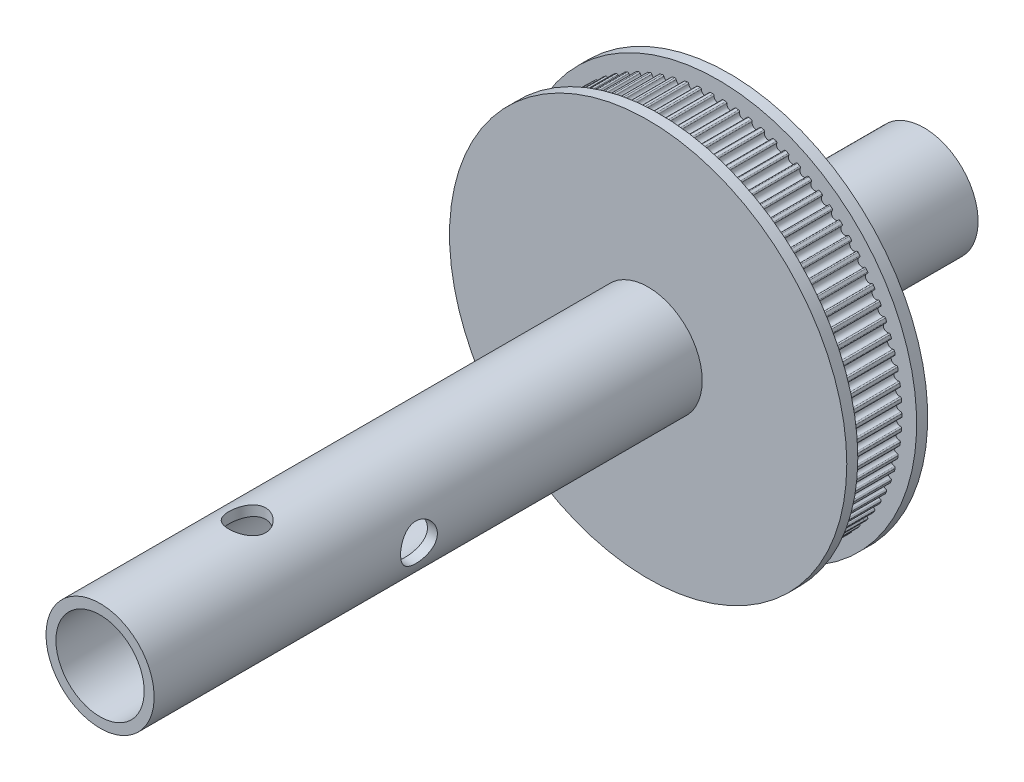
from build123d import *

# Parameters (mm, degrees)
Y_KSEKLIK_EKSTR_ZYON1_DEPTH = 23
IZIM2_R                     = 45
Y_KSEKLIK_EKSTR_ZYON2_DEPTH = 12
IZIM3_R                     = 10
KES_EKSTR_ZYON1_DEPTH       = 94
PAH1_SIZE                   = 1
SCALE1_SCALE                = 0.218169125
SKETCH4_R                   = 9.817610612
CUT_EXTRUDE1_DEPTH          = 36.702971501
BOSS_EXTRUDE4_DEPTH         = 2.98211013
SKETCH16_R                  = 27
BOSS_EXTRUDE5_DEPTH         = 1.5
BOSS_EXTRUDE6_START         = 1.5
SKETCH17_R                  = 27
BOSS_EXTRUDE6_DEPTH         = 1.5
SKETCH18_R                  = 6
CUT_EXTRUDE5_DEPTH          = 40.736632972
BOSS_EXTRUDE7_DEPTH         = 32
BOSS_EXTRUDE7_DEPTH_BACK    = 80
SKETCH20_R                  = 7.35
SKETCH20_R_2                = 6
CUT_EXTRUDE6_DEPTH          = 99.699845827
CUT_EXTRUDE6_DEPTH_BACK     = 99.699845827
SKETCH21_R                  = 2.5
CUT_EXTRUDE7_DEPTH          = 99.699845919
CUT_EXTRUDE7_DEPTH_BACK     = 99.699845919
SKETCH22_R                  = 2.5
SKETCH23_R                  = 2


with BuildPart() as part:
    # Çizim1 → Yükseklik-Ekstrüzyon1 (new body)
    with BuildSketch(Plane.XY):
        with BuildLine():
            ThreePointArc((0, 111.23), (1.781971913, 111.994070727), (2.456990514, 113.811645447))
            ThreePointArc((2.456990514, 113.811645447), (2.655804987, 114.335821771), (3.175532645, 114.545991167))
            ThreePointArc((3.175532645, 114.545991167), (3.999133327, 114.520194868), (4.822527218, 114.488476849))
            ThreePointArc((4.822527218, 114.488476849), (5.32632817, 114.242565047), (5.488093649, 113.705796993))
            ThreePointArc((5.488093649, 113.705796993), (6.034680335, 111.845562876), (7.759012575, 110.95904931))
            ThreePointArc((7.759012575, 110.95904931), (9.589942573, 111.596954722), (10.390104466, 113.363015005))
            ThreePointArc((10.390104466, 113.363015005), (10.624999329, 113.872045865), (11.158121632, 114.04544893))
            ThreePointArc((11.158121632, 114.04544893), (11.977916606, 113.96226399), (12.797092214, 113.87318618))
            ThreePointArc((12.797092214, 113.87318618), (13.282511991, 113.592730029), (13.406440371, 113.045985326))
            ThreePointArc((13.406440371, 113.045985326), (13.821932227, 111.152154686), (15.48022402, 110.147517286))
            ThreePointArc((15.48022402, 110.147517286), (17.351191997, 110.656149572), (18.272598873, 112.362091348))
            ThreePointArc((18.272598873, 112.362091348), (18.542429742, 112.853496798), (19.086349373, 112.98928873))
            ThreePointArc((19.086349373, 112.98928873), (19.898344679, 112.849120418), (20.709311062, 112.703116795))
            ThreePointArc((20.709311062, 112.703116795), (21.173984749, 112.389482649), (21.259472264, 111.835424982))
            ThreePointArc((21.259472264, 111.835424982), (21.541845055, 109.917224371), (23.12601737, 108.79935763))
            ThreePointArc((23.12601737, 108.79935763), (25.027908158, 109.176238784), (26.066071016, 110.813750878))
            ThreePointArc((26.066071016, 110.813750878), (26.369523302, 111.285136838), (26.921590338, 111.382656072))
            ThreePointArc((26.921590338, 111.382656072), (27.721830017, 111.186187274), (28.520636229, 110.983969154))
            ThreePointArc((28.520636229, 110.983969154), (28.962299982, 110.638685006), (29.008930144, 110.080013689))
            ThreePointArc((29.008930144, 110.080013689), (29.156808179, 108.146788388), (30.659143088, 106.921138439))
            ThreePointArc((30.659143088, 106.921138439), (32.582690866, 107.164432335), (33.73255188, 108.725536952))
            ThreePointArc((33.73255188, 108.725536952), (34.068147194, 109.174606878), (34.625672021, 109.233378311))
            ThreePointArc((34.625672021, 109.233378311), (35.410257385, 108.981566202), (36.193011723, 108.724118771))
            ThreePointArc((36.193011723, 108.724118771), (36.609513801, 108.348866812), (36.617059433, 107.788303634))
            ThreePointArc((36.617059433, 107.788303634), (36.629722264, 105.849472123), (38.042900542, 104.52201021))
            ThreePointArc((38.042900542, 104.52201021), (39.978733979, 104.630531544), (41.234691143, 106.107623138))
            ThreePointArc((41.234691143, 106.107623138), (41.600794498, 106.532189208), (42.16106091, 106.55192651))
            ThreePointArc((42.16106091, 106.55192651), (42.92616954, 106.245997895), (43.689058502, 105.93457541))
            ThreePointArc((43.689058502, 105.93457541), (44.078369748, 105.53118383), (44.046794089, 104.971459799))
            ThreePointArc((44.046794089, 104.971459799), (43.924180025, 103.036467869), (45.241316809, 101.613661254))
            ThreePointArc((45.241316809, 101.613661254), (47.180004719, 101.586881321), (48.535939136, 102.972763651))
            ThreePointArc((48.535939136, 102.972763651), (48.930766913, 103.37075742), (49.491045348, 103.351364434))
            ThreePointArc((49.491045348, 103.351364434), (50.232949711, 102.992809765), (50.972256579, 102.628929446))
            ThreePointArc((50.972256579, 102.628929446), (51.332480309, 102.199363528), (51.261937191, 101.643205563))
            ThreePointArc((51.261937191, 101.643205563), (51.004643595, 99.721480302), (52.219321929, 98.210260754))
            ThreePointArc((52.219321929, 98.210260754), (54.151419218, 98.048310024), (55.600724911, 99.336231211))
            ThreePointArc((55.600724911, 99.336231211), (56.02235355, 99.705713693), (56.579914389, 99.647284899))
            ThreePointArc((56.579914389, 99.647284899), (57.295, 99.23785102), (58.007122946, 98.823285654))
            ThreePointArc((58.007122946, 98.823285654), (58.336504185, 98.3696382), (58.227337289, 97.819755847))
            ThreePointArc((58.227337289, 97.819755847), (57.836617669, 95.920659706), (58.942919761, 94.328389735))
            ThreePointArc((58.942919761, 94.328389735), (60.859013447, 94.032057215), (62.394629544, 95.215742637))
            ThreePointArc((62.394629544, 95.215742637), (62.841004911, 95.554913751), (63.393131774, 95.457733809))
            ThreePointArc((63.393131774, 95.457733809), (64.077914809, 94.999415439), (64.759384441, 94.536184748))
            ThreePointArc((64.759384441, 94.536184748), (65.056318478, 94.060665883), (64.909059652, 93.519738114))
            ThreePointArc((64.909059652, 93.519738114), (64.386817556, 91.652523298), (65.379353612, 89.986960284))
            ThreePointArc((65.379353612, 89.986960284), (67.270108679, 89.557689676), (68.884553814, 90.631372535))
            ThreePointArc((68.884553814, 90.631372535), (69.353501214, 90.938579874), (69.897504193, 90.803122235))
            ThreePointArc((69.897504193, 90.803122235), (70.548648458, 90.298152256), (71.196144725, 89.788513053))
            ThreePointArc((71.196144725, 89.788513053), (71.459184926, 89.293439457), (71.274551602, 88.764101616))
            ThreePointArc((71.274551602, 88.764101616), (70.623331339, 86.937865009), (71.497265825, 85.207123408))
            ThreePointArc((71.497265825, 85.207123408), (73.353470704, 84.647006076), (75.038879461, 85.605455498))
            ThreePointArc((75.038879461, 85.605455498), (75.52811423, 85.879202378), (76.061342998, 85.706126977))
            ThreePointArc((76.061342998, 85.706126977), (76.675676183, 85.156965551), (77.286044548, 84.603400748))
            ThreePointArc((77.286044548, 84.603400748), (77.513909408, 84.091184369), (77.2928011, 83.576015339))
            ThreePointArc((77.2928011, 83.576015339), (76.515775352, 81.799654181), (77.266850546, 80.012165992))
            ThreePointArc((77.266850546, 80.012165992), (79.079461992, 79.32393077), (80.827623231, 80.162477286))
            ThreePointArc((80.827623231, 80.162477286), (81.334761866, 80.40143004), (81.854618585, 80.191580083))
            ThreePointArc((81.854618585, 80.191580083), (82.429147721, 79.600902671), (82.999414531, 79.006109179))
            ThreePointArc((82.999414531, 79.006109179), (83.190993915, 78.479245484), (82.934487841, 77.980755115))
            ThreePointArc((82.934487841, 77.980755115), (82.035442198, 76.262923661), (82.659998938, 74.427397345))
            ThreePointArc((82.659998938, 74.427397345), (84.420186092, 73.614397247), (86.222582945, 74.328955542))
            ThreePointArc((86.222582945, 74.328955542), (86.745154717, 74.531950017), (87.249106699, 74.286347872))
            ThreePointArc((87.249106699, 74.286347872), (87.781032737, 73.657032194), (88.308419709, 73.023907787))
            ThreePointArc((88.308419709, 73.023907787), (88.462780262, 72.484963603), (88.172126093, 72.005580492))
            ThreePointArc((88.172126093, 72.005580492), (87.155440616, 70.354647842), (87.650436124, 68.4800259))
            ThreePointArc((87.650436124, 68.4800259), (89.34962353, 67.546221781), (91.197474903, 68.133310599))
            ThreePointArc((91.197474903, 68.133310599), (91.732933895, 68.299357825), (92.218525935, 68.019200042))
            ThreePointArc((92.218525935, 68.019200042), (92.705257385, 67.35431206), (93.187195143, 66.685941257))
            ThreePointArc((93.187195143, 66.685941257), (93.303584836, 66.137542267), (92.980198611, 65.679601918))
            ThreePointArc((92.980198611, 65.679601918), (91.850826488, 64.103611251), (92.213849195, 62.199026653))
            ThreePointArc((92.213849195, 62.199026653), (93.843758584, 61.148967912), (95.728061929, 61.605727015))
            ThreePointArc((95.728061929, 61.605727015), (96.273799439, 61.734018027), (96.738665783, 61.420669506))
            ThreePointArc((96.738665783, 61.420669506), (97.177831339, 60.723448488), (97.61197193, 60.023087525))
            ThreePointArc((97.61197193, 60.023087525), (97.689823723, 59.467905472), (97.335280947, 59.033638925))
            ThreePointArc((97.335280947, 59.033638925), (96.098724366, 57.540268309), (96.328005663, 55.615))
            ThreePointArc((96.328005663, 55.615), (97.880696279, 54.453802418), (99.792271461, 54.778006522))
            ThreePointArc((99.792271461, 54.778006522), (100.34562871, 54.867916299), (100.787504575, 54.522903642))
            ThreePointArc((100.787504575, 54.522903642), (101.176964666, 53.79674638), (101.561193001, 53.067807343))
            ThreePointArc((101.561193001, 53.067807343), (101.600127609, 52.508547019), (101.216155578, 52.100069978))
            ThreePointArc((101.216155578, 52.100069978), (99.878438919, 50.696594964), (99.97286177, 48.760022657))
            ThreePointArc((99.97286177, 48.760022657), (101.440769061, 47.493343472), (103.370303077, 47.683413087))
            ThreePointArc((103.370303077, 47.683413087), (103.928584164, 47.734503598), (104.345316776, 47.359507673))
            ThreePointArc((104.345316776, 47.359507673), (104.683173991, 46.60795193), (105.015618149, 45.853986139))
            ThreePointArc((105.015618149, 45.853986139), (105.015445886, 45.293372204), (104.603915274, 44.912674727))
            ThreePointArc((104.603915274, 44.912674727), (103.171555757, 43.605932905), (103.130660143, 41.667491386))
            ThreePointArc((103.130660143, 41.667491386), (104.506632613, 40.30150173), (106.444724967, 40.356510857))
            ThreePointArc((106.444724967, 40.356510857), (107.005210004, 40.368533194), (107.394769082, 39.965380942))
            ThreePointArc((107.394769082, 39.965380942), (107.679377416, 39.192088224), (107.958417761, 38.416768923))
            ThreePointArc((107.958417761, 38.416768923), (107.919139467, 37.857532632), (107.482055209, 37.50646944))
            ThreePointArc((107.482055209, 37.50646944), (105.962031146, 36.302827124), (105.786016308, 34.371960284))
            ThreePointArc((105.786016308, 34.371960284), (107.063350356, 32.913315124), (109.000558857, 32.832995762))
            ThreePointArc((109.000558857, 32.832995762), (109.560517216, 32.805891354), (109.921004868, 32.376546893))
            ThreePointArc((109.921004868, 32.376546893), (110.150977738, 31.585284603), (110.375254814, 30.792389071))
            ThreePointArc((110.375254814, 30.792389071), (110.297061848, 30.237254967), (109.836553375, 29.917536403))
            ThreePointArc((109.836553375, 29.917536403), (108.236270171, 28.822857618), (107.925993634, 26.908972448))
            ThreePointArc((107.925993634, 26.908972448), (109.098466218, 25.364778154), (111.02535298, 25.149521613))
            ThreePointArc((111.02535298, 25.149521613), (111.582056602, 25.083422509), (111.911716568, 24.629977562))
            ThreePointArc((111.911716568, 24.629977562), (112.085933568, 23.824600651), (112.254354721, 23.017991794))
            ThreePointArc((112.254354721, 23.017991794), (112.137628031, 22.469664434), (111.655938894, 22.182848136))
            ThreePointArc((111.655938894, 22.182848136), (109.983192968, 21.202466047), (109.540166368, 19.314886802))
            ThreePointArc((109.540166368, 19.314886802), (110.602065318, 17.692666535), (112.509242745, 17.343521522))
            ThreePointArc((112.509242745, 17.343521522), (113.059979424, 17.238749751), (113.357205635, 16.763413456))
            ThreePointArc((113.357205635, 16.763413456), (113.474817997, 15.947845639), (113.586562695, 15.131453175))
            ThreePointArc((113.586562695, 15.131453175), (113.431870962, 14.592603956), (112.931347902, 14.340087263))
            ThreePointArc((112.931347902, 14.340087263), (111.194288703, 13.478778193), (110.620670422, 11.626700969))
            ThreePointArc((110.620670422, 11.626700969), (111.566822275, 9.934358023), (113.444998788, 9.453025538))
            ThreePointArc((113.444998788, 9.453025538), (113.98708539, 9.310091537), (114.25042979, 8.815179685))
            ThreePointArc((114.25042979, 8.815179685), (114.310864519, 7.993394326), (114.365388353, 7.171195637))
            ThreePointArc((114.365388353, 7.171195637), (114.17348522, 6.644449777), (113.656566736, 6.427462927))
            ThreePointArc((113.656566736, 6.427462927), (111.863657042, 5.689423086), (111.162241689, 3.881871018))
            ThreePointArc((111.162241689, 3.881871018), (111.988036888, 2.127650318), (113.8280622, 1.516475363))
            ThreePointArc((113.8280622, 1.516475363), (114.358857735, 1.336075493), (114.587037335, 0.823999245))
            ThreePointArc((114.587037335, 0.823999245), (114.59, 0), (114.587037335, -0.823999245))
            ThreePointArc((114.587037335, -0.823999245), (114.358857735, -1.336075493), (113.8280622, -1.516475363))
            ThreePointArc((113.8280622, -1.516475363), (111.988036888, -2.127650318), (111.162241689, -3.881871018))
            ThreePointArc((111.162241689, -3.881871018), (111.863657042, -5.689423086), (113.656566736, -6.427462927))
            ThreePointArc((113.656566736, -6.427462927), (114.17348522, -6.644449777), (114.365388353, -7.171195637))
            ThreePointArc((114.365388353, -7.171195637), (114.310864519, -7.993394326), (114.25042979, -8.815179685))
            ThreePointArc((114.25042979, -8.815179685), (113.98708539, -9.310091537), (113.444998788, -9.453025538))
            ThreePointArc((113.444998788, -9.453025538), (111.566822275, -9.934358023), (110.620670422, -11.626700969))
            ThreePointArc((110.620670422, -11.626700969), (111.194288703, -13.478778193), (112.931347902, -14.340087263))
            ThreePointArc((112.931347902, -14.340087263), (113.431870962, -14.592603956), (113.586562695, -15.131453175))
            ThreePointArc((113.586562695, -15.131453175), (113.474817997, -15.947845639), (113.357205635, -16.763413456))
            ThreePointArc((113.357205635, -16.763413456), (113.059979424, -17.238749751), (112.509242745, -17.343521522))
            ThreePointArc((112.509242745, -17.343521522), (110.602065318, -17.692666535), (109.540166368, -19.314886802))
            ThreePointArc((109.540166368, -19.314886802), (109.983192968, -21.202466047), (111.655938894, -22.182848136))
            ThreePointArc((111.655938894, -22.182848136), (112.137628031, -22.469664434), (112.254354721, -23.017991794))
            ThreePointArc((112.254354721, -23.017991794), (112.085933568, -23.824600651), (111.911716568, -24.629977562))
            ThreePointArc((111.911716568, -24.629977562), (111.582056602, -25.083422509), (111.02535298, -25.149521613))
            ThreePointArc((111.02535298, -25.149521613), (109.098466218, -25.364778154), (107.925993634, -26.908972448))
            ThreePointArc((107.925993634, -26.908972448), (108.236270171, -28.822857618), (109.836553375, -29.917536403))
            ThreePointArc((109.836553375, -29.917536403), (110.297061848, -30.237254967), (110.375254814, -30.792389071))
            ThreePointArc((110.375254814, -30.792389071), (110.150977738, -31.585284603), (109.921004868, -32.376546893))
            ThreePointArc((109.921004868, -32.376546893), (109.560517216, -32.805891354), (109.000558857, -32.832995762))
            ThreePointArc((109.000558857, -32.832995762), (107.063350356, -32.913315124), (105.786016308, -34.371960284))
            ThreePointArc((105.786016308, -34.371960284), (105.962031146, -36.302827124), (107.482055209, -37.50646944))
            ThreePointArc((107.482055209, -37.50646944), (107.919139467, -37.857532632), (107.958417761, -38.416768923))
            ThreePointArc((107.958417761, -38.416768923), (107.679377416, -39.192088224), (107.394769082, -39.965380942))
            ThreePointArc((107.394769082, -39.965380942), (107.005210004, -40.368533194), (106.444724967, -40.356510857))
            ThreePointArc((106.444724967, -40.356510857), (104.506632613, -40.30150173), (103.130660143, -41.667491386))
            ThreePointArc((103.130660143, -41.667491386), (103.171555757, -43.605932905), (104.603915274, -44.912674727))
            ThreePointArc((104.603915274, -44.912674727), (105.015445886, -45.293372204), (105.015618149, -45.853986139))
            ThreePointArc((105.015618149, -45.853986139), (104.683173991, -46.60795193), (104.345316776, -47.359507673))
            ThreePointArc((104.345316776, -47.359507673), (103.928584164, -47.734503598), (103.370303077, -47.683413087))
            ThreePointArc((103.370303077, -47.683413087), (101.440769061, -47.493343472), (99.97286177, -48.760022657))
            ThreePointArc((99.97286177, -48.760022657), (99.878438919, -50.696594964), (101.216155578, -52.100069978))
            ThreePointArc((101.216155578, -52.100069978), (101.600127609, -52.508547019), (101.561193001, -53.067807343))
            ThreePointArc((101.561193001, -53.067807343), (101.176964666, -53.79674638), (100.787504575, -54.522903642))
            ThreePointArc((100.787504575, -54.522903642), (100.34562871, -54.867916299), (99.792271461, -54.778006522))
            ThreePointArc((99.792271461, -54.778006522), (97.880696279, -54.453802418), (96.328005663, -55.615))
            ThreePointArc((96.328005663, -55.615), (96.098724366, -57.540268309), (97.335280947, -59.033638925))
            ThreePointArc((97.335280947, -59.033638925), (97.689823723, -59.467905472), (97.61197193, -60.023087525))
            ThreePointArc((97.61197193, -60.023087525), (97.177831339, -60.723448488), (96.738665783, -61.420669506))
            ThreePointArc((96.738665783, -61.420669506), (96.273799439, -61.734018027), (95.728061929, -61.605727015))
            ThreePointArc((95.728061929, -61.605727015), (93.843758584, -61.148967912), (92.213849195, -62.199026653))
            ThreePointArc((92.213849195, -62.199026653), (91.850826488, -64.103611251), (92.980198611, -65.679601918))
            ThreePointArc((92.980198611, -65.679601918), (93.303584836, -66.137542267), (93.187195143, -66.685941257))
            ThreePointArc((93.187195143, -66.685941257), (92.705257385, -67.35431206), (92.218525935, -68.019200042))
            ThreePointArc((92.218525935, -68.019200042), (91.732933895, -68.299357825), (91.197474903, -68.133310599))
            ThreePointArc((91.197474903, -68.133310599), (89.34962353, -67.546221781), (87.650436124, -68.4800259))
            ThreePointArc((87.650436124, -68.4800259), (87.155440616, -70.354647842), (88.172126093, -72.005580492))
            ThreePointArc((88.172126093, -72.005580492), (88.462780262, -72.484963603), (88.308419709, -73.023907787))
            ThreePointArc((88.308419709, -73.023907787), (87.781032737, -73.657032194), (87.249106699, -74.286347872))
            ThreePointArc((87.249106699, -74.286347872), (86.745154717, -74.531950017), (86.222582945, -74.328955542))
            ThreePointArc((86.222582945, -74.328955542), (84.420186092, -73.614397247), (82.659998938, -74.427397345))
            ThreePointArc((82.659998938, -74.427397345), (82.035442198, -76.262923661), (82.934487841, -77.980755115))
            ThreePointArc((82.934487841, -77.980755115), (83.190993915, -78.479245484), (82.999414531, -79.006109179))
            ThreePointArc((82.999414531, -79.006109179), (82.429147721, -79.600902671), (81.854618585, -80.191580083))
            ThreePointArc((81.854618585, -80.191580083), (81.334761866, -80.40143004), (80.827623231, -80.162477286))
            ThreePointArc((80.827623231, -80.162477286), (79.079461992, -79.32393077), (77.266850546, -80.012165992))
            ThreePointArc((77.266850546, -80.012165992), (76.515775352, -81.799654181), (77.2928011, -83.576015339))
            ThreePointArc((77.2928011, -83.576015339), (77.513909408, -84.091184369), (77.286044548, -84.603400748))
            ThreePointArc((77.286044548, -84.603400748), (76.675676183, -85.156965551), (76.061342998, -85.706126977))
            ThreePointArc((76.061342998, -85.706126977), (75.52811423, -85.879202378), (75.038879461, -85.605455498))
            ThreePointArc((75.038879461, -85.605455498), (73.353470704, -84.647006076), (71.497265825, -85.207123408))
            ThreePointArc((71.497265825, -85.207123408), (70.623331339, -86.937865009), (71.274551602, -88.764101616))
            ThreePointArc((71.274551602, -88.764101616), (71.459184926, -89.293439457), (71.196144725, -89.788513053))
            ThreePointArc((71.196144725, -89.788513053), (70.548648458, -90.298152256), (69.897504193, -90.803122235))
            ThreePointArc((69.897504193, -90.803122235), (69.353501214, -90.938579874), (68.884553814, -90.631372535))
            ThreePointArc((68.884553814, -90.631372535), (67.270108679, -89.557689676), (65.379353613, -89.986960284))
            ThreePointArc((65.379353613, -89.986960284), (64.386817556, -91.652523298), (64.909059652, -93.519738114))
            ThreePointArc((64.909059652, -93.519738114), (65.056318478, -94.060665883), (64.759384441, -94.536184748))
            ThreePointArc((64.759384441, -94.536184748), (64.077914809, -94.999415439), (63.393131774, -95.457733809))
            ThreePointArc((63.393131774, -95.457733809), (62.841004911, -95.554913751), (62.394629544, -95.215742637))
            ThreePointArc((62.394629544, -95.215742637), (60.859013447, -94.032057215), (58.942919761, -94.328389735))
            ThreePointArc((58.942919761, -94.328389735), (57.836617669, -95.920659706), (58.227337289, -97.819755847))
            ThreePointArc((58.227337289, -97.819755847), (58.336504186, -98.3696382), (58.007122946, -98.823285654))
            ThreePointArc((58.007122946, -98.823285654), (57.295, -99.23785102), (56.579914389, -99.647284899))
            ThreePointArc((56.579914389, -99.647284899), (56.02235355, -99.705713693), (55.600724911, -99.336231211))
            ThreePointArc((55.600724911, -99.336231211), (54.151419218, -98.048310024), (52.219321929, -98.210260754))
            ThreePointArc((52.219321929, -98.210260754), (51.004643595, -99.721480302), (51.261937191, -101.643205563))
            ThreePointArc((51.261937191, -101.643205563), (51.332480309, -102.199363528), (50.972256579, -102.628929446))
            ThreePointArc((50.972256579, -102.628929446), (50.232949711, -102.992809765), (49.491045348, -103.351364434))
            ThreePointArc((49.491045348, -103.351364434), (48.930766913, -103.37075742), (48.535939136, -102.972763651))
            ThreePointArc((48.535939136, -102.972763651), (47.180004719, -101.586881321), (45.241316809, -101.613661254))
            ThreePointArc((45.241316809, -101.613661254), (43.924180025, -103.036467869), (44.046794089, -104.971459799))
            ThreePointArc((44.046794089, -104.971459799), (44.078369748, -105.53118383), (43.689058502, -105.93457541))
            ThreePointArc((43.689058502, -105.93457541), (42.92616954, -106.245997895), (42.16106091, -106.55192651))
            ThreePointArc((42.16106091, -106.55192651), (41.600794498, -106.532189208), (41.234691143, -106.107623138))
            ThreePointArc((41.234691143, -106.107623138), (39.978733979, -104.630531544), (38.042900542, -104.52201021))
            ThreePointArc((38.042900542, -104.52201021), (36.629722264, -105.849472123), (36.617059433, -107.788303634))
            ThreePointArc((36.617059433, -107.788303634), (36.609513801, -108.348866812), (36.193011723, -108.724118771))
            ThreePointArc((36.193011723, -108.724118771), (35.410257385, -108.981566202), (34.625672021, -109.233378311))
            ThreePointArc((34.625672021, -109.233378311), (34.068147194, -109.174606878), (33.73255188, -108.725536952))
            ThreePointArc((33.73255188, -108.725536952), (32.582690866, -107.164432335), (30.659143088, -106.921138439))
            ThreePointArc((30.659143088, -106.921138439), (29.156808179, -108.146788388), (29.008930144, -110.080013689))
            ThreePointArc((29.008930144, -110.080013689), (28.962299982, -110.638685006), (28.520636229, -110.983969154))
            ThreePointArc((28.520636229, -110.983969154), (27.721830017, -111.186187274), (26.921590338, -111.382656072))
            ThreePointArc((26.921590338, -111.382656072), (26.369523302, -111.285136838), (26.066071016, -110.813750878))
            ThreePointArc((26.066071016, -110.813750878), (25.027908158, -109.176238784), (23.12601737, -108.79935763))
            ThreePointArc((23.12601737, -108.79935763), (21.541845055, -109.917224371), (21.259472264, -111.835424982))
            ThreePointArc((21.259472264, -111.835424982), (21.173984749, -112.389482649), (20.709311062, -112.703116795))
            ThreePointArc((20.709311062, -112.703116795), (19.898344679, -112.849120418), (19.086349373, -112.98928873))
            ThreePointArc((19.086349373, -112.98928873), (18.542429742, -112.853496798), (18.272598873, -112.362091348))
            ThreePointArc((18.272598873, -112.362091348), (17.351191997, -110.656149572), (15.48022402, -110.147517286))
            ThreePointArc((15.48022402, -110.147517286), (13.821932227, -111.152154686), (13.406440371, -113.045985326))
            ThreePointArc((13.406440371, -113.045985326), (13.282511991, -113.592730029), (12.797092214, -113.87318618))
            ThreePointArc((12.797092214, -113.87318618), (11.977916606, -113.96226399), (11.158121632, -114.04544893))
            ThreePointArc((11.158121632, -114.04544893), (10.624999329, -113.872045865), (10.390104466, -113.363015005))
            ThreePointArc((10.390104466, -113.363015005), (9.589942573, -111.596954722), (7.759012575, -110.95904931))
            ThreePointArc((7.759012575, -110.95904931), (6.034680335, -111.845562876), (5.488093649, -113.705796993))
            ThreePointArc((5.488093649, -113.705796993), (5.32632817, -114.242565047), (4.822527218, -114.488476849))
            ThreePointArc((4.822527218, -114.488476849), (3.999133327, -114.520194868), (3.175532645, -114.545991167))
            ThreePointArc((3.175532645, -114.545991167), (2.655804987, -114.335821771), (2.456990514, -113.811645447))
            ThreePointArc((2.456990514, -113.811645447), (1.781971913, -111.994070727), (0, -111.23))
            ThreePointArc((0, -111.23), (-1.781971913, -111.994070727), (-2.456990514, -113.811645447))
            ThreePointArc((-2.456990514, -113.811645447), (-2.655804987, -114.335821771), (-3.175532645, -114.545991167))
            ThreePointArc((-3.175532645, -114.545991167), (-3.999133327, -114.520194868), (-4.822527218, -114.488476849))
            ThreePointArc((-4.822527218, -114.488476849), (-5.32632817, -114.242565047), (-5.488093649, -113.705796993))
            ThreePointArc((-5.488093649, -113.705796993), (-6.034680335, -111.845562876), (-7.759012575, -110.95904931))
            ThreePointArc((-7.759012575, -110.95904931), (-9.589942573, -111.596954722), (-10.390104466, -113.363015005))
            ThreePointArc((-10.390104466, -113.363015005), (-10.624999329, -113.872045865), (-11.158121632, -114.04544893))
            ThreePointArc((-11.158121632, -114.04544893), (-11.977916606, -113.96226399), (-12.797092214, -113.87318618))
            ThreePointArc((-12.797092214, -113.87318618), (-13.282511991, -113.592730029), (-13.406440371, -113.045985326))
            ThreePointArc((-13.406440371, -113.045985326), (-13.821932227, -111.152154686), (-15.48022402, -110.147517286))
            ThreePointArc((-15.48022402, -110.147517286), (-17.351191997, -110.656149572), (-18.272598873, -112.362091348))
            ThreePointArc((-18.272598873, -112.362091348), (-18.542429742, -112.853496798), (-19.086349373, -112.98928873))
            ThreePointArc((-19.086349373, -112.98928873), (-19.898344679, -112.849120418), (-20.709311062, -112.703116795))
            ThreePointArc((-20.709311062, -112.703116795), (-21.173984749, -112.389482649), (-21.259472264, -111.835424982))
            ThreePointArc((-21.259472264, -111.835424982), (-21.541845055, -109.917224371), (-23.12601737, -108.79935763))
            ThreePointArc((-23.12601737, -108.79935763), (-25.027908158, -109.176238784), (-26.066071016, -110.813750878))
            ThreePointArc((-26.066071016, -110.813750878), (-26.369523302, -111.285136838), (-26.921590338, -111.382656072))
            ThreePointArc((-26.921590338, -111.382656072), (-27.721830017, -111.186187274), (-28.520636229, -110.983969154))
            ThreePointArc((-28.520636229, -110.983969154), (-28.962299982, -110.638685006), (-29.008930144, -110.080013689))
            ThreePointArc((-29.008930144, -110.080013689), (-29.156808179, -108.146788388), (-30.659143088, -106.921138439))
            ThreePointArc((-30.659143088, -106.921138439), (-32.582690866, -107.164432335), (-33.73255188, -108.725536952))
            ThreePointArc((-33.73255188, -108.725536952), (-34.068147194, -109.174606878), (-34.625672021, -109.233378311))
            ThreePointArc((-34.625672021, -109.233378311), (-35.410257385, -108.981566202), (-36.193011723, -108.724118771))
            ThreePointArc((-36.193011723, -108.724118771), (-36.609513801, -108.348866812), (-36.617059433, -107.788303634))
            ThreePointArc((-36.617059433, -107.788303634), (-36.629722264, -105.849472123), (-38.042900542, -104.52201021))
            ThreePointArc((-38.042900542, -104.52201021), (-39.978733979, -104.630531544), (-41.234691143, -106.107623138))
            ThreePointArc((-41.234691143, -106.107623138), (-41.600794498, -106.532189208), (-42.16106091, -106.55192651))
            ThreePointArc((-42.16106091, -106.55192651), (-42.92616954, -106.245997895), (-43.689058502, -105.93457541))
            ThreePointArc((-43.689058502, -105.93457541), (-44.078369748, -105.53118383), (-44.046794089, -104.971459799))
            ThreePointArc((-44.046794089, -104.971459799), (-43.924180025, -103.036467869), (-45.241316809, -101.613661254))
            ThreePointArc((-45.241316809, -101.613661254), (-47.180004719, -101.586881321), (-48.535939136, -102.972763651))
            ThreePointArc((-48.535939136, -102.972763651), (-48.930766913, -103.37075742), (-49.491045348, -103.351364434))
            ThreePointArc((-49.491045348, -103.351364434), (-50.232949711, -102.992809765), (-50.972256579, -102.628929446))
            ThreePointArc((-50.972256579, -102.628929446), (-51.332480309, -102.199363528), (-51.261937191, -101.643205563))
            ThreePointArc((-51.261937191, -101.643205563), (-51.004643595, -99.721480302), (-52.219321929, -98.210260754))
            ThreePointArc((-52.219321929, -98.210260754), (-54.151419218, -98.048310024), (-55.600724911, -99.336231211))
            ThreePointArc((-55.600724911, -99.336231211), (-56.02235355, -99.705713693), (-56.579914389, -99.647284899))
            ThreePointArc((-56.579914389, -99.647284899), (-57.295, -99.23785102), (-58.007122946, -98.823285654))
            ThreePointArc((-58.007122946, -98.823285654), (-58.336504185, -98.3696382), (-58.227337289, -97.819755847))
            ThreePointArc((-58.227337289, -97.819755847), (-57.836617669, -95.920659706), (-58.942919761, -94.328389735))
            ThreePointArc((-58.942919761, -94.328389735), (-60.859013447, -94.032057215), (-62.394629544, -95.215742637))
            ThreePointArc((-62.394629544, -95.215742637), (-62.841004911, -95.554913751), (-63.393131774, -95.457733809))
            ThreePointArc((-63.393131774, -95.457733809), (-64.077914809, -94.999415439), (-64.759384441, -94.536184748))
            ThreePointArc((-64.759384441, -94.536184748), (-65.056318478, -94.060665883), (-64.909059652, -93.519738114))
            ThreePointArc((-64.909059652, -93.519738114), (-64.386817556, -91.652523298), (-65.379353612, -89.986960284))
            ThreePointArc((-65.379353612, -89.986960284), (-67.270108679, -89.557689676), (-68.884553814, -90.631372535))
            ThreePointArc((-68.884553814, -90.631372535), (-69.353501214, -90.938579874), (-69.897504193, -90.803122235))
            ThreePointArc((-69.897504193, -90.803122235), (-70.548648458, -90.298152256), (-71.196144725, -89.788513053))
            ThreePointArc((-71.196144725, -89.788513053), (-71.459184926, -89.293439457), (-71.274551602, -88.764101616))
            ThreePointArc((-71.274551602, -88.764101616), (-70.623331339, -86.937865009), (-71.497265825, -85.207123408))
            ThreePointArc((-71.497265825, -85.207123408), (-73.353470704, -84.647006076), (-75.038879461, -85.605455498))
            ThreePointArc((-75.038879461, -85.605455498), (-75.52811423, -85.879202378), (-76.061342998, -85.706126977))
            ThreePointArc((-76.061342998, -85.706126977), (-76.675676183, -85.156965551), (-77.286044548, -84.603400748))
            ThreePointArc((-77.286044548, -84.603400748), (-77.513909408, -84.091184369), (-77.2928011, -83.576015339))
            ThreePointArc((-77.2928011, -83.576015339), (-76.515775352, -81.799654181), (-77.266850546, -80.012165992))
            ThreePointArc((-77.266850546, -80.012165992), (-79.079461992, -79.32393077), (-80.827623231, -80.162477286))
            ThreePointArc((-80.827623231, -80.162477286), (-81.334761866, -80.40143004), (-81.854618585, -80.191580083))
            ThreePointArc((-81.854618585, -80.191580083), (-82.429147721, -79.600902671), (-82.999414531, -79.006109179))
            ThreePointArc((-82.999414531, -79.006109179), (-83.190993915, -78.479245484), (-82.934487841, -77.980755115))
            ThreePointArc((-82.934487841, -77.980755115), (-82.035442198, -76.262923661), (-82.659998938, -74.427397345))
            ThreePointArc((-82.659998938, -74.427397345), (-84.420186092, -73.614397247), (-86.222582945, -74.328955542))
            ThreePointArc((-86.222582945, -74.328955542), (-86.745154717, -74.531950017), (-87.249106699, -74.286347872))
            ThreePointArc((-87.249106699, -74.286347872), (-87.781032737, -73.657032194), (-88.308419709, -73.023907787))
            ThreePointArc((-88.308419709, -73.023907787), (-88.462780262, -72.484963603), (-88.172126093, -72.005580492))
            ThreePointArc((-88.172126093, -72.005580492), (-87.155440616, -70.354647842), (-87.650436124, -68.4800259))
            ThreePointArc((-87.650436124, -68.4800259), (-89.34962353, -67.546221781), (-91.197474903, -68.133310599))
            ThreePointArc((-91.197474903, -68.133310599), (-91.732933895, -68.299357825), (-92.218525935, -68.019200042))
            ThreePointArc((-92.218525935, -68.019200042), (-92.705257385, -67.35431206), (-93.187195143, -66.685941257))
            ThreePointArc((-93.187195143, -66.685941257), (-93.303584836, -66.137542267), (-92.980198611, -65.679601918))
            ThreePointArc((-92.980198611, -65.679601918), (-91.850826488, -64.103611251), (-92.213849195, -62.199026653))
            ThreePointArc((-92.213849195, -62.199026653), (-93.843758584, -61.148967912), (-95.728061929, -61.605727015))
            ThreePointArc((-95.728061929, -61.605727015), (-96.273799439, -61.734018027), (-96.738665783, -61.420669506))
            ThreePointArc((-96.738665783, -61.420669506), (-97.177831339, -60.723448488), (-97.61197193, -60.023087525))
            ThreePointArc((-97.61197193, -60.023087525), (-97.689823723, -59.467905472), (-97.335280947, -59.033638925))
            ThreePointArc((-97.335280947, -59.033638925), (-96.098724366, -57.540268309), (-96.328005663, -55.615))
            ThreePointArc((-96.328005663, -55.615), (-97.880696279, -54.453802418), (-99.792271461, -54.778006522))
            ThreePointArc((-99.792271461, -54.778006522), (-100.34562871, -54.867916299), (-100.787504575, -54.522903642))
            ThreePointArc((-100.787504575, -54.522903642), (-101.176964666, -53.79674638), (-101.561193001, -53.067807343))
            ThreePointArc((-101.561193001, -53.067807343), (-101.600127609, -52.508547019), (-101.216155578, -52.100069978))
            ThreePointArc((-101.216155578, -52.100069978), (-99.878438919, -50.696594964), (-99.97286177, -48.760022657))
            ThreePointArc((-99.97286177, -48.760022657), (-101.440769061, -47.493343472), (-103.370303077, -47.683413087))
            ThreePointArc((-103.370303077, -47.683413087), (-103.928584164, -47.734503598), (-104.345316776, -47.359507673))
            ThreePointArc((-104.345316776, -47.359507673), (-104.683173991, -46.60795193), (-105.015618149, -45.853986139))
            ThreePointArc((-105.015618149, -45.853986139), (-105.015445886, -45.293372204), (-104.603915274, -44.912674727))
            ThreePointArc((-104.603915274, -44.912674727), (-103.171555757, -43.605932905), (-103.130660143, -41.667491386))
            ThreePointArc((-103.130660143, -41.667491386), (-104.506632613, -40.30150173), (-106.444724967, -40.356510857))
            ThreePointArc((-106.444724967, -40.356510857), (-107.005210004, -40.368533194), (-107.394769082, -39.965380942))
            ThreePointArc((-107.394769082, -39.965380942), (-107.679377416, -39.192088224), (-107.958417761, -38.416768923))
            ThreePointArc((-107.958417761, -38.416768923), (-107.919139467, -37.857532632), (-107.482055209, -37.50646944))
            ThreePointArc((-107.482055209, -37.50646944), (-105.962031146, -36.302827124), (-105.786016308, -34.371960284))
            ThreePointArc((-105.786016308, -34.371960284), (-107.063350356, -32.913315124), (-109.000558857, -32.832995762))
            ThreePointArc((-109.000558857, -32.832995762), (-109.560517216, -32.805891354), (-109.921004868, -32.376546893))
            ThreePointArc((-109.921004868, -32.376546893), (-110.150977738, -31.585284603), (-110.375254814, -30.792389071))
            ThreePointArc((-110.375254814, -30.792389071), (-110.297061848, -30.237254967), (-109.836553375, -29.917536403))
            ThreePointArc((-109.836553375, -29.917536403), (-108.236270171, -28.822857618), (-107.925993634, -26.908972448))
            ThreePointArc((-107.925993634, -26.908972448), (-109.098466218, -25.364778154), (-111.02535298, -25.149521613))
            ThreePointArc((-111.02535298, -25.149521613), (-111.582056602, -25.083422509), (-111.911716568, -24.629977562))
            ThreePointArc((-111.911716568, -24.629977562), (-112.085933568, -23.824600651), (-112.254354721, -23.017991794))
            ThreePointArc((-112.254354721, -23.017991794), (-112.137628031, -22.469664434), (-111.655938894, -22.182848136))
            ThreePointArc((-111.655938894, -22.182848136), (-109.983192968, -21.202466047), (-109.540166368, -19.314886802))
            ThreePointArc((-109.540166368, -19.314886802), (-110.602065318, -17.692666535), (-112.509242745, -17.343521522))
            ThreePointArc((-112.509242745, -17.343521522), (-113.059979424, -17.238749751), (-113.357205635, -16.763413456))
            ThreePointArc((-113.357205635, -16.763413456), (-113.474817997, -15.947845639), (-113.586562695, -15.131453175))
            ThreePointArc((-113.586562695, -15.131453175), (-113.431870962, -14.592603956), (-112.931347902, -14.340087263))
            ThreePointArc((-112.931347902, -14.340087263), (-111.194288703, -13.478778193), (-110.620670422, -11.626700969))
            ThreePointArc((-110.620670422, -11.626700969), (-111.566822275, -9.934358023), (-113.444998788, -9.453025538))
            ThreePointArc((-113.444998788, -9.453025538), (-113.98708539, -9.310091537), (-114.25042979, -8.815179685))
            ThreePointArc((-114.25042979, -8.815179685), (-114.310864519, -7.993394326), (-114.365388353, -7.171195637))
            ThreePointArc((-114.365388353, -7.171195637), (-114.17348522, -6.644449777), (-113.656566736, -6.427462927))
            ThreePointArc((-113.656566736, -6.427462927), (-111.863657042, -5.689423086), (-111.162241689, -3.881871018))
            ThreePointArc((-111.162241689, -3.881871018), (-111.988036888, -2.127650318), (-113.8280622, -1.516475363))
            ThreePointArc((-113.8280622, -1.516475363), (-114.358857735, -1.336075493), (-114.587037335, -0.823999245))
            ThreePointArc((-114.587037335, -0.823999245), (-114.59, 0), (-114.587037335, 0.823999245))
            ThreePointArc((-114.587037335, 0.823999245), (-114.358857735, 1.336075493), (-113.8280622, 1.516475363))
            ThreePointArc((-113.8280622, 1.516475363), (-111.988036888, 2.127650318), (-111.162241689, 3.881871018))
            ThreePointArc((-111.162241689, 3.881871018), (-111.863657042, 5.689423086), (-113.656566736, 6.427462927))
            ThreePointArc((-113.656566736, 6.427462927), (-114.17348522, 6.644449777), (-114.365388353, 7.171195637))
            ThreePointArc((-114.365388353, 7.171195637), (-114.310864519, 7.993394326), (-114.25042979, 8.815179685))
            ThreePointArc((-114.25042979, 8.815179685), (-113.98708539, 9.310091537), (-113.444998788, 9.453025538))
            ThreePointArc((-113.444998788, 9.453025538), (-111.566822275, 9.934358023), (-110.620670422, 11.626700969))
            ThreePointArc((-110.620670422, 11.626700969), (-111.194288703, 13.478778193), (-112.931347902, 14.340087263))
            ThreePointArc((-112.931347902, 14.340087263), (-113.431870962, 14.592603956), (-113.586562695, 15.131453175))
            ThreePointArc((-113.586562695, 15.131453175), (-113.474817997, 15.947845639), (-113.357205635, 16.763413456))
            ThreePointArc((-113.357205635, 16.763413456), (-113.059979424, 17.238749751), (-112.509242745, 17.343521522))
            ThreePointArc((-112.509242745, 17.343521522), (-110.602065318, 17.692666535), (-109.540166368, 19.314886802))
            ThreePointArc((-109.540166368, 19.314886802), (-109.983192968, 21.202466047), (-111.655938894, 22.182848136))
            ThreePointArc((-111.655938894, 22.182848136), (-112.137628031, 22.469664434), (-112.254354721, 23.017991794))
            ThreePointArc((-112.254354721, 23.017991794), (-112.085933568, 23.824600651), (-111.911716568, 24.629977562))
            ThreePointArc((-111.911716568, 24.629977562), (-111.582056602, 25.083422509), (-111.02535298, 25.149521613))
            ThreePointArc((-111.02535298, 25.149521613), (-109.098466218, 25.364778154), (-107.925993634, 26.908972448))
            ThreePointArc((-107.925993634, 26.908972448), (-108.236270171, 28.822857618), (-109.836553375, 29.917536403))
            ThreePointArc((-109.836553375, 29.917536403), (-110.297061848, 30.237254967), (-110.375254814, 30.792389071))
            ThreePointArc((-110.375254814, 30.792389071), (-110.150977738, 31.585284603), (-109.921004868, 32.376546893))
            ThreePointArc((-109.921004868, 32.376546893), (-109.560517216, 32.805891354), (-109.000558857, 32.832995762))
            ThreePointArc((-109.000558857, 32.832995762), (-107.063350356, 32.913315124), (-105.786016308, 34.371960284))
            ThreePointArc((-105.786016308, 34.371960284), (-105.962031146, 36.302827124), (-107.482055209, 37.50646944))
            ThreePointArc((-107.482055209, 37.50646944), (-107.919139467, 37.857532632), (-107.958417761, 38.416768923))
            ThreePointArc((-107.958417761, 38.416768923), (-107.679377416, 39.192088224), (-107.394769082, 39.965380942))
            ThreePointArc((-107.394769082, 39.965380942), (-107.005210004, 40.368533194), (-106.444724967, 40.356510857))
            ThreePointArc((-106.444724967, 40.356510857), (-104.506632613, 40.30150173), (-103.130660143, 41.667491386))
            ThreePointArc((-103.130660143, 41.667491386), (-103.171555757, 43.605932905), (-104.603915274, 44.912674727))
            ThreePointArc((-104.603915274, 44.912674727), (-105.015445886, 45.293372204), (-105.015618149, 45.853986139))
            ThreePointArc((-105.015618149, 45.853986139), (-104.683173991, 46.60795193), (-104.345316776, 47.359507673))
            ThreePointArc((-104.345316776, 47.359507673), (-103.928584164, 47.734503598), (-103.370303077, 47.683413087))
            ThreePointArc((-103.370303077, 47.683413087), (-101.440769061, 47.493343472), (-99.97286177, 48.760022657))
            ThreePointArc((-99.97286177, 48.760022657), (-99.878438919, 50.696594964), (-101.216155578, 52.100069978))
            ThreePointArc((-101.216155578, 52.100069978), (-101.600127609, 52.508547019), (-101.561193001, 53.067807343))
            ThreePointArc((-101.561193001, 53.067807343), (-101.176964666, 53.79674638), (-100.787504575, 54.522903642))
            ThreePointArc((-100.787504575, 54.522903642), (-100.34562871, 54.867916299), (-99.792271461, 54.778006522))
            ThreePointArc((-99.792271461, 54.778006522), (-97.880696279, 54.453802418), (-96.328005663, 55.615))
            ThreePointArc((-96.328005663, 55.615), (-96.098724366, 57.540268309), (-97.335280947, 59.033638925))
            ThreePointArc((-97.335280947, 59.033638925), (-97.689823723, 59.467905472), (-97.61197193, 60.023087525))
            ThreePointArc((-97.61197193, 60.023087525), (-97.177831339, 60.723448488), (-96.738665783, 61.420669506))
            ThreePointArc((-96.738665783, 61.420669506), (-96.273799439, 61.734018027), (-95.728061929, 61.605727015))
            ThreePointArc((-95.728061929, 61.605727015), (-93.843758584, 61.148967912), (-92.213849195, 62.199026653))
            ThreePointArc((-92.213849195, 62.199026653), (-91.850826488, 64.103611251), (-92.980198611, 65.679601918))
            ThreePointArc((-92.980198611, 65.679601918), (-93.303584836, 66.137542267), (-93.187195143, 66.685941257))
            ThreePointArc((-93.187195143, 66.685941257), (-92.705257385, 67.35431206), (-92.218525935, 68.019200042))
            ThreePointArc((-92.218525935, 68.019200042), (-91.732933895, 68.299357825), (-91.197474903, 68.133310599))
            ThreePointArc((-91.197474903, 68.133310599), (-89.34962353, 67.546221781), (-87.650436124, 68.4800259))
            ThreePointArc((-87.650436124, 68.4800259), (-87.155440616, 70.354647842), (-88.172126093, 72.005580492))
            ThreePointArc((-88.172126093, 72.005580492), (-88.462780262, 72.484963603), (-88.308419709, 73.023907787))
            ThreePointArc((-88.308419709, 73.023907787), (-87.781032737, 73.657032194), (-87.249106699, 74.286347872))
            ThreePointArc((-87.249106699, 74.286347872), (-86.745154717, 74.531950017), (-86.222582945, 74.328955542))
            ThreePointArc((-86.222582945, 74.328955542), (-84.420186092, 73.614397247), (-82.659998938, 74.427397345))
            ThreePointArc((-82.659998938, 74.427397345), (-82.035442198, 76.262923661), (-82.934487841, 77.980755115))
            ThreePointArc((-82.934487841, 77.980755115), (-83.190993915, 78.479245484), (-82.999414531, 79.006109179))
            ThreePointArc((-82.999414531, 79.006109179), (-82.429147721, 79.600902671), (-81.854618585, 80.191580083))
            ThreePointArc((-81.854618585, 80.191580083), (-81.334761866, 80.40143004), (-80.827623231, 80.162477286))
            ThreePointArc((-80.827623231, 80.162477286), (-79.079461992, 79.32393077), (-77.266850546, 80.012165992))
            ThreePointArc((-77.266850546, 80.012165992), (-76.515775352, 81.799654181), (-77.2928011, 83.576015339))
            ThreePointArc((-77.2928011, 83.576015339), (-77.513909408, 84.091184369), (-77.286044548, 84.603400748))
            ThreePointArc((-77.286044548, 84.603400748), (-76.675676183, 85.156965551), (-76.061342998, 85.706126977))
            ThreePointArc((-76.061342998, 85.706126977), (-75.52811423, 85.879202378), (-75.038879461, 85.605455498))
            ThreePointArc((-75.038879461, 85.605455498), (-73.353470704, 84.647006076), (-71.497265825, 85.207123408))
            ThreePointArc((-71.497265825, 85.207123408), (-70.623331339, 86.937865009), (-71.274551602, 88.764101616))
            ThreePointArc((-71.274551602, 88.764101616), (-71.459184926, 89.293439457), (-71.196144725, 89.788513053))
            ThreePointArc((-71.196144725, 89.788513053), (-70.548648458, 90.298152256), (-69.897504193, 90.803122235))
            ThreePointArc((-69.897504193, 90.803122235), (-69.353501214, 90.938579874), (-68.884553814, 90.631372535))
            ThreePointArc((-68.884553814, 90.631372535), (-67.270108679, 89.557689676), (-65.379353613, 89.986960284))
            ThreePointArc((-65.379353613, 89.986960284), (-64.386817556, 91.652523298), (-64.909059652, 93.519738114))
            ThreePointArc((-64.909059652, 93.519738114), (-65.056318478, 94.060665883), (-64.759384441, 94.536184748))
            ThreePointArc((-64.759384441, 94.536184748), (-64.077914809, 94.999415439), (-63.393131774, 95.457733809))
            ThreePointArc((-63.393131774, 95.457733809), (-62.841004911, 95.554913751), (-62.394629544, 95.215742637))
            ThreePointArc((-62.394629544, 95.215742637), (-60.859013447, 94.032057215), (-58.942919761, 94.328389735))
            ThreePointArc((-58.942919761, 94.328389735), (-57.836617669, 95.920659706), (-58.227337289, 97.819755847))
            ThreePointArc((-58.227337289, 97.819755847), (-58.336504186, 98.3696382), (-58.007122946, 98.823285654))
            ThreePointArc((-58.007122946, 98.823285654), (-57.295, 99.23785102), (-56.579914389, 99.647284899))
            ThreePointArc((-56.579914389, 99.647284899), (-56.02235355, 99.705713693), (-55.600724911, 99.336231211))
            ThreePointArc((-55.600724911, 99.336231211), (-54.151419218, 98.048310024), (-52.219321929, 98.210260754))
            ThreePointArc((-52.219321929, 98.210260754), (-51.004643595, 99.721480302), (-51.261937191, 101.643205563))
            ThreePointArc((-51.261937191, 101.643205563), (-51.332480309, 102.199363528), (-50.972256579, 102.628929446))
            ThreePointArc((-50.972256579, 102.628929446), (-50.232949711, 102.992809765), (-49.491045348, 103.351364434))
            ThreePointArc((-49.491045348, 103.351364434), (-48.930766913, 103.37075742), (-48.535939136, 102.972763651))
            ThreePointArc((-48.535939136, 102.972763651), (-47.180004719, 101.586881321), (-45.241316809, 101.613661254))
            ThreePointArc((-45.241316809, 101.613661254), (-43.924180025, 103.036467869), (-44.046794089, 104.971459799))
            ThreePointArc((-44.046794089, 104.971459799), (-44.078369748, 105.53118383), (-43.689058502, 105.93457541))
            ThreePointArc((-43.689058502, 105.93457541), (-42.92616954, 106.245997895), (-42.16106091, 106.55192651))
            ThreePointArc((-42.16106091, 106.55192651), (-41.600794498, 106.532189208), (-41.234691143, 106.107623138))
            ThreePointArc((-41.234691143, 106.107623138), (-39.978733979, 104.630531544), (-38.042900542, 104.52201021))
            ThreePointArc((-38.042900542, 104.52201021), (-36.629722264, 105.849472123), (-36.617059433, 107.788303634))
            ThreePointArc((-36.617059433, 107.788303634), (-36.609513801, 108.348866812), (-36.193011723, 108.724118771))
            ThreePointArc((-36.193011723, 108.724118771), (-35.410257385, 108.981566202), (-34.625672021, 109.233378311))
            ThreePointArc((-34.625672021, 109.233378311), (-34.068147194, 109.174606878), (-33.73255188, 108.725536952))
            ThreePointArc((-33.73255188, 108.725536952), (-32.582690866, 107.164432335), (-30.659143088, 106.921138439))
            ThreePointArc((-30.659143088, 106.921138439), (-29.156808179, 108.146788388), (-29.008930144, 110.080013689))
            ThreePointArc((-29.008930144, 110.080013689), (-28.962299982, 110.638685006), (-28.520636229, 110.983969154))
            ThreePointArc((-28.520636229, 110.983969154), (-27.721830017, 111.186187274), (-26.921590338, 111.382656072))
            ThreePointArc((-26.921590338, 111.382656072), (-26.369523302, 111.285136838), (-26.066071016, 110.813750878))
            ThreePointArc((-26.066071016, 110.813750878), (-25.027908158, 109.176238784), (-23.12601737, 108.79935763))
            ThreePointArc((-23.12601737, 108.79935763), (-21.541845055, 109.917224371), (-21.259472264, 111.835424982))
            ThreePointArc((-21.259472264, 111.835424982), (-21.173984749, 112.389482649), (-20.709311062, 112.703116795))
            ThreePointArc((-20.709311062, 112.703116795), (-19.898344679, 112.849120418), (-19.086349373, 112.98928873))
            ThreePointArc((-19.086349373, 112.98928873), (-18.542429742, 112.853496798), (-18.272598873, 112.362091348))
            ThreePointArc((-18.272598873, 112.362091348), (-17.351191997, 110.656149572), (-15.48022402, 110.147517286))
            ThreePointArc((-15.48022402, 110.147517286), (-13.821932227, 111.152154686), (-13.406440371, 113.045985326))
            ThreePointArc((-13.406440371, 113.045985326), (-13.282511991, 113.592730029), (-12.797092214, 113.87318618))
            ThreePointArc((-12.797092214, 113.87318618), (-11.977916606, 113.96226399), (-11.158121632, 114.04544893))
            ThreePointArc((-11.158121632, 114.04544893), (-10.624999329, 113.872045865), (-10.390104466, 113.363015005))
            ThreePointArc((-10.390104466, 113.363015005), (-9.589942573, 111.596954722), (-7.759012575, 110.95904931))
            ThreePointArc((-7.759012575, 110.95904931), (-6.034680335, 111.845562876), (-5.488093649, 113.705796993))
            ThreePointArc((-5.488093649, 113.705796993), (-5.32632817, 114.242565047), (-4.822527218, 114.488476849))
            ThreePointArc((-4.822527218, 114.488476849), (-3.999133327, 114.520194868), (-3.175532645, 114.545991167))
            ThreePointArc((-3.175532645, 114.545991167), (-2.655804987, 114.335821771), (-2.456990514, 113.811645447))
            ThreePointArc((-2.456990514, 113.811645447), (-1.781971913, 111.994070727), (0, 111.23))
        make_face()
    extrude(amount=Y_KSEKLIK_EKSTR_ZYON1_DEPTH)

    # Çizim2 → Yükseklik-Ekstrüzyon2 (add)
    with BuildSketch(Plane.XY.offset(23)):
        Circle(IZIM2_R)
    extrude(amount=Y_KSEKLIK_EKSTR_ZYON2_DEPTH)

    # Çizim3 → Kes-Ekstrüzyon1 (cut)
    with BuildSketch(Plane.XY.offset(35)):
        Circle(IZIM3_R)
    extrude(amount=-KES_EKSTR_ZYON1_DEPTH, mode=Mode.SUBTRACT)

    # Pah1
    pah1_edges = [part.edges().sort_by_distance(p)[0] for p in [
        (-45, 0, 35),
    ]]
    chamfer(pah1_edges, length=PAH1_SIZE)


with BuildPart() as part_1:
    # Scale1: scaled about (0, 0, 12.786297236)
    add(part.part.scale(SCALE1_SCALE).moved(Location((0, 0, 9.99672196))))

    # Sketch4 → Cut-Extrude1 (cut, through all)
    with BuildSketch(Plane.XY.offset(15.014611828)):
        Circle(SKETCH4_R)
    extrude(amount=CUT_EXTRUDE1_DEPTH, mode=Mode.SUBTRACT)

    # Sketch15 → Boss-Extrude4 (add)
    with BuildSketch(Plane(origin=(0, 0, 9.99672196), x_dir=(-1, 0, 0), z_dir=(0, 0, -1))):
        with BuildLine():
            ThreePointArc((-0.53603947, 24.830187068), (-0.579414649, 24.944546158), (-0.692803178, 24.990398631))
            ThreePointArc((-0.692803178, 24.990398631), (-0.872487418, 24.984770675), (-1.052126542, 24.977850783))
            ThreePointArc((-1.052126542, 24.977850783), (-1.162040355, 24.92420042), (-1.197332588, 24.807094204))
            ThreePointArc((-1.197332588, 24.807094204), (-1.692776982, 24.207838666), (-2.266799997, 24.732309758))
            ThreePointArc((-2.266799997, 24.732309758), (-2.318046804, 24.843364575), (-2.43435763, 24.88119577))
            ThreePointArc((-2.43435763, 24.88119577), (-2.613211582, 24.863047384), (-2.791930407, 24.843613356))
            ThreePointArc((-2.791930407, 24.843613356), (-2.897834015, 24.782426483), (-2.924871361, 24.66314367))
            ThreePointArc((-2.924871361, 24.66314367), (-3.377306925, 24.030787435), (-3.986516902, 24.51393912))
            ThreePointArc((-3.986516902, 24.51393912), (-4.045385667, 24.621148616), (-4.164052136, 24.650774223))
            ThreePointArc((-4.164052136, 24.650774223), (-4.341204442, 24.620193825), (-4.518132268, 24.588340343))
            ThreePointArc((-4.518132268, 24.588340343), (-4.619509719, 24.519915056), (-4.638160455, 24.399036779))
            ThreePointArc((-4.638160455, 24.399036779), (-5.045382967, 23.736660623), (-5.686811898, 24.176139034))
            ThreePointArc((-5.686811898, 24.176139034), (-5.753015818, 24.278980897), (-5.8734598, 24.300256583))
            ThreePointArc((-5.8734598, 24.300256583), (-6.04804739, 24.257393157), (-6.222322242, 24.213275407))
            ThreePointArc((-6.222322242, 24.213275407), (-6.318679637, 24.137945066), (-6.328852898, 24.016060234))
            ThreePointArc((-6.328852898, 24.016060234), (-6.688878412, 23.326891186), (-7.359401318, 23.72055523))
            ThreePointArc((-7.359401318, 23.72055523), (-7.432617854, 23.818528423), (-7.554252557, 23.831350535))
            ThreePointArc((-7.554252557, 23.831350535), (-7.725424859, 23.776412907), (-7.896197688, 23.720245827))
            ThreePointArc((-7.896197688, 23.720245827), (-7.987065582, 23.638377435), (-7.988711806, 23.516079857))
            ThreePointArc((-7.988711806, 23.516079857), (-8.299786313, 22.80347548), (-8.996136474, 23.149407265))
            ThreePointArc((-8.996136474, 23.149407265), (-9.076008923, 23.242034472), (-9.198241755, 23.246340542))
            ThreePointArc((-9.198241755, 23.246340542), (-9.365164835, 23.179596364), (-9.531603653, 23.111653593))
            ThreePointArc((-9.531603653, 23.111653593), (-9.616539346, 23.023646005), (-9.609650512, 22.901531503))
            ThreePointArc((-9.609650512, 22.901531503), (-9.870258489, 22.168963534), (-10.589043358, 22.465477714))
            ThreePointArc((-10.589043358, 22.465477714), (-10.675182589, 22.552307666), (-10.797418044, 22.548076716))
            ThreePointArc((-10.797418044, 22.548076716), (-10.95927867, 22.469851157), (-11.120572602, 22.390463707))
            ThreePointArc((-11.120572602, 22.390463707), (-11.199162298, 22.296745686), (-11.183771968, 22.17540919))
            ThreePointArc((-11.183771968, 22.17540919), (-11.392643758, 21.426446626), (-12.130361487, 21.672098615))
            ThreePointArc((-12.130361487, 21.672098615), (-12.222347838, 21.752708284), (-12.343990398, 21.739960926))
            ThreePointArc((-12.343990398, 21.739960926), (-12.5, 21.650635095), (-12.65536324, 21.560189732))
            ThreePointArc((-12.65536324, 21.560189732), (-12.727224057, 21.461217864), (-12.70340721, 21.341250512))
            ThreePointArc((-12.70340721, 21.341250512), (-12.859525212, 20.579542223), (-13.612581714, 20.773135229))
            ThreePointArc((-13.612581714, 20.773135229), (-13.709967037, 20.847131894), (-13.830424071, 20.825930231))
            ThreePointArc((-13.830424071, 20.825930231), (-13.979822587, 20.725939314), (-14.12849822, 20.62487668))
            ThreePointArc((-14.12849822, 20.62487668), (-14.193280059, 20.521133145), (-14.16115273, 20.403119407))
            ThreePointArc((-14.16115273, 20.403119407), (-14.263756351, 19.63237636), (-15.028482811, 19.772967217))
            ThreePointArc((-15.028482811, 19.772967217), (-15.130792655, 19.839990373), (-15.249477309, 19.810437698))
            ThreePointArc((-15.249477309, 19.810437698), (-15.391536883, 19.70026884), (-15.532800577, 19.589081301))
            ThreePointArc((-15.532800577, 19.589081301), (-15.590187827, 19.481071528), (-15.549906537, 19.365586355))
            ThreePointArc((-15.549906537, 19.365586355), (-15.598495904, 18.589563533), (-16.371166651, 18.676467296))
            ThreePointArc((-16.371166651, 18.676467296), (-16.477902572, 18.736190413), (-16.594236626, 18.698430704))
            ThreePointArc((-16.594236626, 18.698430704), (-16.728265159, 18.578620637), (-16.861428691, 18.457849888))
            ThreePointArc((-16.861428691, 18.457849888), (-16.911141768, 18.346100089), (-16.862902762, 18.233706113))
            ThreePointArc((-16.862902762, 18.233706113), (-16.857241152, 17.45618422), (-17.634091812, 17.488977504))
            ThreePointArc((-17.634091812, 17.488977504), (-17.744733804, 17.541109617), (-17.85815049, 17.495326835))
            ThreePointArc((-17.85815049, 17.495326835), (-17.983495008, 17.366459261), (-18.107909619, 17.236693686))
            ThreePointArc((-18.107909619, 17.236693686), (-18.149706326, 17.121748295), (-18.09374462, 17.012993087))
            ThreePointArc((-18.09374462, 17.012993087), (-18.033859616, 16.237760133), (-18.811105451, 16.216283171))
            ThreePointArc((-18.811105451, 16.216283171), (-18.925114477, 16.260570298), (-19.03506124, 16.206987493))
            ThreePointArc((-19.03506124, 16.206987493), (-19.151111078, 16.069690242), (-19.266170632, 15.931562045))
            ThreePointArc((-19.266170632, 15.931562045), (-19.299847339, 15.813981064), (-19.236435573, 15.70939447))
            ThreePointArc((-19.236435573, 15.70939447), (-19.122618929, 14.940227311), (-19.896473275, 14.864584737))
            ThreePointArc((-19.896473275, 14.864584737), (-20.013293894, 14.900811115), (-20.119235085, 14.839689336))
            ThreePointArc((-20.119235085, 14.839689336), (-20.225424859, 14.694631307), (-20.330568798, 14.548813434))
            ThreePointArc((-20.330568798, 14.548813434), (-20.355961435, 14.429169706), (-20.285408546, 14.329261261))
            ThreePointArc((-20.285408546, 14.329261261), (-20.118214765, 13.569907202), (-20.884907481, 13.44046754))
            ThreePointArc((-20.884907481, 13.44046754), (-21.003970556, 13.468456678), (-21.105390039, 13.400093705))
            ThreePointArc((-21.105390039, 13.400093705), (-21.201202404, 13.247981606), (-21.295918477, 13.095184467))
            ThreePointArc((-21.295918477, 13.095184467), (-21.312903334, 12.974060885), (-21.235553047, 12.879317333))
            ThreePointArc((-21.235553047, 12.879317333), (-21.01579668, 12.13347587), (-21.771592517, 11.950869736))
            ThreePointArc((-21.771592517, 11.950869736), (-21.892317984, 11.970485273), (-21.988721654, 11.895214164))
            ThreePointArc((-21.988721654, 11.895214164), (-22.073689821, 11.73678907), (-22.157516581, 11.577757078))
            ThreePointArc((-22.157516581, 11.577757078), (-22.16601091, 11.455743743), (-22.082240069, 11.366626664))
            ThreePointArc((-22.082240069, 11.366626664), (-21.810991747, 10.637931464), (-22.552208543, 10.403048496))
            ThreePointArc((-22.552208543, 10.403048496), (-22.674008239, 10.414194868), (-22.764926428, 10.332382335))
            ThreePointArc((-22.764926428, 10.332382335), (-22.838636441, 10.168416077), (-22.911165492, 10.00392402))
            ThreePointArc((-22.911165492, 10.00392402), (-22.911127909, 9.881615369), (-22.821344636, 9.798558933))
            ThreePointArc((-22.821344636, 9.798558933), (-22.499925854, 9.090560124), (-23.222952476, 8.80454465))
            ThreePointArc((-23.222952476, 8.80454465), (-23.345233005, 8.807167553), (-23.430222769, 8.719212179))
            ThreePointArc((-23.430222769, 8.719212179), (-23.49231552, 8.550503583), (-23.553193508, 8.38135285))
            ThreePointArc((-23.553193508, 8.38135285), (-23.544624196, 8.259344758), (-23.449265906, 8.182753608))
            ThreePointArc((-23.449265906, 8.182753608), (-23.079242584, 7.49890049), (-23.780556518, 7.163145947))
            ThreePointArc((-23.780556518, 7.163145947), (-23.902722143, 7.157232602), (-23.981369419, 7.063562897))
            ThreePointArc((-23.981369419, 7.063562897), (-24.031542398, 6.890933895), (-24.080472732, 6.717948571))
            ThreePointArc((-24.080472732, 6.717948571), (-24.063413441, 6.59683545), (-23.962944711, 6.52708273))
            ThreePointArc((-23.962944711, 6.52708273), (-23.546119564, 5.870706966), (-24.22230408, 5.486849117))
            ThreePointArc((-24.22230408, 5.486849117), (-24.343759622, 5.472428333), (-24.415681248, 5.373500646))
            ThreePointArc((-24.415681248, 5.373500646), (-24.453690018, 5.19779227), (-24.490434314, 5.021815122))
            ThreePointArc((-24.490434314, 5.021815122), (-24.464968154, 4.902187022), (-24.359878457, 4.839612561))
            ThreePointArc((-24.359878457, 4.839612561), (-23.898282217, 4.213911947), (-24.546043011, 3.78382091))
            ThreePointArc((-24.546043011, 3.78382091), (-24.66619675, 3.760962944), (-24.731042332, 3.657259241))
            ThreePointArc((-24.731042332, 3.657259241), (-24.756701719, 3.479327524), (-24.781080961, 3.301215895))
            ThreePointArc((-24.781080961, 3.301215895), (-24.747332002, 3.183655632), (-24.638133324, 3.128564286))
            ThreePointArc((-24.638133324, 3.128564286), (-24.13401484, 2.536587174), (-24.750196088, 2.062358307))
            ThreePointArc((-24.750196088, 2.062358307), (-24.868462647, 2.031174522), (-24.925916264, 1.923200036))
            ThreePointArc((-24.925916264, 1.923200036), (-24.939101256, 1.743911844), (-24.950996674, 1.564533475))
            ThreePointArc((-24.950996674, 1.564533475), (-24.909129335, 1.449613792), (-24.796353682, 1.402273961))
            ThreePointArc((-24.796353682, 1.402273961), (-24.25216897, 0.846904402), (-24.833768697, 0.330848103))
            ThreePointArc((-24.833768697, 0.330848103), (-24.949571894, 0.291490421), (-24.999353638, 0.179771194))
            ThreePointArc((-24.999353638, 0.179771194), (-25, 0), (-24.999353638, -0.179771194))
            ThreePointArc((-24.999353638, -0.179771194), (-24.949571894, -0.291490421), (-24.833768697, -0.330848103))
            ThreePointArc((-24.833768697, -0.330848103), (-24.25216897, -0.846904402), (-24.796353682, -1.402273961))
            ThreePointArc((-24.796353682, -1.402273961), (-24.909129335, -1.449613792), (-24.950996674, -1.564533475))
            ThreePointArc((-24.950996674, -1.564533475), (-24.939101256, -1.743911844), (-24.925916264, -1.923200036))
            ThreePointArc((-24.925916264, -1.923200036), (-24.868462647, -2.031174522), (-24.750196088, -2.062358307))
            ThreePointArc((-24.750196088, -2.062358307), (-24.13401484, -2.536587174), (-24.638133324, -3.128564286))
            ThreePointArc((-24.638133324, -3.128564286), (-24.747332002, -3.183655632), (-24.781080961, -3.301215895))
            ThreePointArc((-24.781080961, -3.301215895), (-24.756701719, -3.479327524), (-24.731042332, -3.657259241))
            ThreePointArc((-24.731042332, -3.657259241), (-24.66619675, -3.760962944), (-24.546043011, -3.78382091))
            ThreePointArc((-24.546043011, -3.78382091), (-23.898282217, -4.213911947), (-24.359878457, -4.839612561))
            ThreePointArc((-24.359878457, -4.839612561), (-24.464968154, -4.902187022), (-24.490434314, -5.021815122))
            ThreePointArc((-24.490434314, -5.021815122), (-24.453690018, -5.19779227), (-24.415681248, -5.373500646))
            ThreePointArc((-24.415681248, -5.373500646), (-24.343759622, -5.472428333), (-24.22230408, -5.486849117))
            ThreePointArc((-24.22230408, -5.486849117), (-23.546119564, -5.870706966), (-23.962944711, -6.52708273))
            ThreePointArc((-23.962944711, -6.52708273), (-24.063413441, -6.59683545), (-24.080472732, -6.717948571))
            ThreePointArc((-24.080472732, -6.717948571), (-24.031542398, -6.890933895), (-23.981369419, -7.063562897))
            ThreePointArc((-23.981369419, -7.063562897), (-23.902722143, -7.157232602), (-23.780556518, -7.163145947))
            ThreePointArc((-23.780556518, -7.163145947), (-23.079242584, -7.49890049), (-23.449265906, -8.182753608))
            ThreePointArc((-23.449265906, -8.182753608), (-23.544624196, -8.259344758), (-23.553193508, -8.38135285))
            ThreePointArc((-23.553193508, -8.38135285), (-23.49231552, -8.550503583), (-23.430222769, -8.719212179))
            ThreePointArc((-23.430222769, -8.719212179), (-23.345233005, -8.807167553), (-23.222952476, -8.80454465))
            ThreePointArc((-23.222952476, -8.80454465), (-22.499925854, -9.090560124), (-22.821344636, -9.798558933))
            ThreePointArc((-22.821344636, -9.798558933), (-22.911127909, -9.881615369), (-22.911165492, -10.00392402))
            ThreePointArc((-22.911165492, -10.00392402), (-22.838636441, -10.168416077), (-22.764926428, -10.332382335))
            ThreePointArc((-22.764926428, -10.332382335), (-22.674008239, -10.414194868), (-22.552208543, -10.403048496))
            ThreePointArc((-22.552208543, -10.403048496), (-21.810991747, -10.637931464), (-22.082240069, -11.366626664))
            ThreePointArc((-22.082240069, -11.366626664), (-22.16601091, -11.455743743), (-22.157516581, -11.577757078))
            ThreePointArc((-22.157516581, -11.577757078), (-22.073689821, -11.73678907), (-21.988721654, -11.895214164))
            ThreePointArc((-21.988721654, -11.895214164), (-21.892317984, -11.970485273), (-21.771592517, -11.950869736))
            ThreePointArc((-21.771592517, -11.950869736), (-21.01579668, -12.13347587), (-21.235553047, -12.879317333))
            ThreePointArc((-21.235553047, -12.879317333), (-21.312903334, -12.974060885), (-21.295918477, -13.095184467))
            ThreePointArc((-21.295918477, -13.095184467), (-21.201202404, -13.247981606), (-21.105390039, -13.400093705))
            ThreePointArc((-21.105390039, -13.400093705), (-21.003970556, -13.468456678), (-20.884907481, -13.44046754))
            ThreePointArc((-20.884907481, -13.44046754), (-20.118214765, -13.569907202), (-20.285408546, -14.329261261))
            ThreePointArc((-20.285408546, -14.329261261), (-20.355961435, -14.429169706), (-20.330568798, -14.548813434))
            ThreePointArc((-20.330568798, -14.548813434), (-20.225424859, -14.694631307), (-20.119235085, -14.839689336))
            ThreePointArc((-20.119235085, -14.839689336), (-20.013293894, -14.900811115), (-19.896473275, -14.864584737))
            ThreePointArc((-19.896473275, -14.864584737), (-19.122618929, -14.940227311), (-19.236435573, -15.70939447))
            ThreePointArc((-19.236435573, -15.70939447), (-19.299847339, -15.813981064), (-19.266170632, -15.931562045))
            ThreePointArc((-19.266170632, -15.931562045), (-19.151111078, -16.069690242), (-19.03506124, -16.206987493))
            ThreePointArc((-19.03506124, -16.206987493), (-18.925114477, -16.260570298), (-18.811105451, -16.216283171))
            ThreePointArc((-18.811105451, -16.216283171), (-18.033859616, -16.237760133), (-18.09374462, -17.012993087))
            ThreePointArc((-18.09374462, -17.012993087), (-18.149706326, -17.121748295), (-18.107909619, -17.236693686))
            ThreePointArc((-18.107909619, -17.236693686), (-17.983495008, -17.366459261), (-17.85815049, -17.495326835))
            ThreePointArc((-17.85815049, -17.495326835), (-17.744733804, -17.541109617), (-17.634091812, -17.488977504))
            ThreePointArc((-17.634091812, -17.488977504), (-16.857241152, -17.45618422), (-16.862902762, -18.233706113))
            ThreePointArc((-16.862902762, -18.233706113), (-16.911141768, -18.346100089), (-16.861428691, -18.457849888))
            ThreePointArc((-16.861428691, -18.457849888), (-16.728265159, -18.578620637), (-16.594236626, -18.698430704))
            ThreePointArc((-16.594236626, -18.698430704), (-16.477902572, -18.736190413), (-16.371166651, -18.676467296))
            ThreePointArc((-16.371166651, -18.676467296), (-15.598495904, -18.589563533), (-15.549906537, -19.365586355))
            ThreePointArc((-15.549906537, -19.365586355), (-15.590187827, -19.481071528), (-15.532800577, -19.589081301))
            ThreePointArc((-15.532800577, -19.589081301), (-15.391536883, -19.70026884), (-15.249477309, -19.810437698))
            ThreePointArc((-15.249477309, -19.810437698), (-15.130792655, -19.839990373), (-15.028482811, -19.772967217))
            ThreePointArc((-15.028482811, -19.772967217), (-14.263756351, -19.63237636), (-14.16115273, -20.403119407))
            ThreePointArc((-14.16115273, -20.403119407), (-14.193280059, -20.521133145), (-14.12849822, -20.62487668))
            ThreePointArc((-14.12849822, -20.62487668), (-13.979822587, -20.725939314), (-13.830424071, -20.825930231))
            ThreePointArc((-13.830424071, -20.825930231), (-13.709967037, -20.847131894), (-13.612581714, -20.773135229))
            ThreePointArc((-13.612581714, -20.773135229), (-12.859525212, -20.579542223), (-12.70340721, -21.341250512))
            ThreePointArc((-12.70340721, -21.341250512), (-12.727224057, -21.461217864), (-12.65536324, -21.560189732))
            ThreePointArc((-12.65536324, -21.560189732), (-12.5, -21.650635095), (-12.343990398, -21.739960926))
            ThreePointArc((-12.343990398, -21.739960926), (-12.222347838, -21.752708284), (-12.130361487, -21.672098615))
            ThreePointArc((-12.130361487, -21.672098615), (-11.392643758, -21.426446626), (-11.183771968, -22.17540919))
            ThreePointArc((-11.183771968, -22.17540919), (-11.199162298, -22.296745686), (-11.120572602, -22.390463707))
            ThreePointArc((-11.120572602, -22.390463707), (-10.95927867, -22.469851157), (-10.797418044, -22.548076716))
            ThreePointArc((-10.797418044, -22.548076716), (-10.675182589, -22.552307666), (-10.589043358, -22.465477714))
            ThreePointArc((-10.589043358, -22.465477714), (-9.870258489, -22.168963534), (-9.609650512, -22.901531503))
            ThreePointArc((-9.609650512, -22.901531503), (-9.616539346, -23.023646005), (-9.531603653, -23.111653593))
            ThreePointArc((-9.531603653, -23.111653593), (-9.365164835, -23.179596364), (-9.198241755, -23.246340542))
            ThreePointArc((-9.198241755, -23.246340542), (-9.076008923, -23.242034472), (-8.996136474, -23.149407265))
            ThreePointArc((-8.996136474, -23.149407265), (-8.299786313, -22.80347548), (-7.988711806, -23.516079857))
            ThreePointArc((-7.988711806, -23.516079857), (-7.987065582, -23.638377435), (-7.896197688, -23.720245827))
            ThreePointArc((-7.896197688, -23.720245827), (-7.725424859, -23.776412907), (-7.554252557, -23.831350535))
            ThreePointArc((-7.554252557, -23.831350535), (-7.432617854, -23.818528423), (-7.359401318, -23.72055523))
            ThreePointArc((-7.359401318, -23.72055523), (-6.688878412, -23.326891186), (-6.328852898, -24.016060234))
            ThreePointArc((-6.328852898, -24.016060234), (-6.318679637, -24.137945066), (-6.222322242, -24.213275407))
            ThreePointArc((-6.222322242, -24.213275407), (-6.04804739, -24.257393157), (-5.8734598, -24.300256583))
            ThreePointArc((-5.8734598, -24.300256583), (-5.753015818, -24.278980897), (-5.686811898, -24.176139034))
            ThreePointArc((-5.686811898, -24.176139034), (-5.045382967, -23.736660623), (-4.638160455, -24.399036779))
            ThreePointArc((-4.638160455, -24.399036779), (-4.619509719, -24.519915056), (-4.518132268, -24.588340343))
            ThreePointArc((-4.518132268, -24.588340343), (-4.341204442, -24.620193825), (-4.164052136, -24.650774223))
            ThreePointArc((-4.164052136, -24.650774223), (-4.045385667, -24.621148616), (-3.986516902, -24.51393912))
            ThreePointArc((-3.986516902, -24.51393912), (-3.377306925, -24.030787435), (-2.924871361, -24.66314367))
            ThreePointArc((-2.924871361, -24.66314367), (-2.897834015, -24.782426483), (-2.791930407, -24.843613356))
            ThreePointArc((-2.791930407, -24.843613356), (-2.613211582, -24.863047384), (-2.43435763, -24.88119577))
            ThreePointArc((-2.43435763, -24.88119577), (-2.318046804, -24.843364575), (-2.266799997, -24.732309758))
            ThreePointArc((-2.266799997, -24.732309758), (-1.692776982, -24.207838666), (-1.197332588, -24.807094204))
            ThreePointArc((-1.197332588, -24.807094204), (-1.162040355, -24.92420042), (-1.052126542, -24.977850783))
            ThreePointArc((-1.052126542, -24.977850783), (-0.872487418, -24.984770675), (-0.692803178, -24.990398631))
            ThreePointArc((-0.692803178, -24.990398631), (-0.579414649, -24.944546158), (-0.53603947, -24.830187068))
            ThreePointArc((-0.53603947, -24.830187068), (0, -24.266951741), (0.53603947, -24.830187068))
            ThreePointArc((0.53603947, -24.830187068), (0.579414649, -24.944546158), (0.692803178, -24.990398631))
            ThreePointArc((0.692803178, -24.990398631), (0.872487418, -24.984770675), (1.052126542, -24.977850783))
            ThreePointArc((1.052126542, -24.977850783), (1.162040355, -24.92420042), (1.197332588, -24.807094204))
            ThreePointArc((1.197332588, -24.807094204), (1.692776982, -24.207838666), (2.266799997, -24.732309758))
            ThreePointArc((2.266799997, -24.732309758), (2.318046804, -24.843364575), (2.43435763, -24.88119577))
            ThreePointArc((2.43435763, -24.88119577), (2.613211582, -24.863047384), (2.791930407, -24.843613356))
            ThreePointArc((2.791930407, -24.843613356), (2.897834015, -24.782426483), (2.924871361, -24.66314367))
            ThreePointArc((2.924871361, -24.66314367), (3.377306925, -24.030787435), (3.986516902, -24.51393912))
            ThreePointArc((3.986516902, -24.51393912), (4.045385667, -24.621148616), (4.164052136, -24.650774223))
            ThreePointArc((4.164052136, -24.650774223), (4.341204442, -24.620193825), (4.518132268, -24.588340343))
            ThreePointArc((4.518132268, -24.588340343), (4.619509719, -24.519915056), (4.638160455, -24.399036779))
            ThreePointArc((4.638160455, -24.399036779), (5.045382967, -23.736660623), (5.686811898, -24.176139034))
            ThreePointArc((5.686811898, -24.176139034), (5.753015818, -24.278980897), (5.8734598, -24.300256583))
            ThreePointArc((5.8734598, -24.300256583), (6.04804739, -24.257393157), (6.222322242, -24.213275407))
            ThreePointArc((6.222322242, -24.213275407), (6.318679637, -24.137945066), (6.328852898, -24.016060234))
            ThreePointArc((6.328852898, -24.016060234), (6.688878412, -23.326891186), (7.359401318, -23.72055523))
            ThreePointArc((7.359401318, -23.72055523), (7.432617854, -23.818528423), (7.554252557, -23.831350535))
            ThreePointArc((7.554252557, -23.831350535), (7.725424859, -23.776412907), (7.896197688, -23.720245827))
            ThreePointArc((7.896197688, -23.720245827), (7.987065582, -23.638377435), (7.988711806, -23.516079857))
            ThreePointArc((7.988711806, -23.516079857), (8.299786313, -22.80347548), (8.996136474, -23.149407265))
            ThreePointArc((8.996136474, -23.149407265), (9.076008923, -23.242034472), (9.198241755, -23.246340542))
            ThreePointArc((9.198241755, -23.246340542), (9.365164835, -23.179596364), (9.531603653, -23.111653593))
            ThreePointArc((9.531603653, -23.111653593), (9.616539346, -23.023646005), (9.609650512, -22.901531503))
            ThreePointArc((9.609650512, -22.901531503), (9.870258489, -22.168963534), (10.589043358, -22.465477714))
            ThreePointArc((10.589043358, -22.465477714), (10.675182589, -22.552307666), (10.797418044, -22.548076716))
            ThreePointArc((10.797418044, -22.548076716), (10.95927867, -22.469851157), (11.120572602, -22.390463707))
            ThreePointArc((11.120572602, -22.390463707), (11.199162298, -22.296745686), (11.183771968, -22.17540919))
            ThreePointArc((11.183771968, -22.17540919), (11.392643758, -21.426446626), (12.130361487, -21.672098615))
            ThreePointArc((12.130361487, -21.672098615), (12.222347838, -21.752708284), (12.343990398, -21.739960926))
            ThreePointArc((12.343990398, -21.739960926), (12.5, -21.650635095), (12.65536324, -21.560189732))
            ThreePointArc((12.65536324, -21.560189732), (12.727224057, -21.461217864), (12.70340721, -21.341250512))
            ThreePointArc((12.70340721, -21.341250512), (12.859525212, -20.579542223), (13.612581714, -20.773135229))
            ThreePointArc((13.612581714, -20.773135229), (13.709967037, -20.847131894), (13.830424071, -20.825930231))
            ThreePointArc((13.830424071, -20.825930231), (13.979822587, -20.725939314), (14.12849822, -20.62487668))
            ThreePointArc((14.12849822, -20.62487668), (14.193280059, -20.521133145), (14.16115273, -20.403119407))
            ThreePointArc((14.16115273, -20.403119407), (14.263756351, -19.63237636), (15.028482811, -19.772967217))
            ThreePointArc((15.028482811, -19.772967217), (15.130792655, -19.839990373), (15.249477309, -19.810437698))
            ThreePointArc((15.249477309, -19.810437698), (15.391536883, -19.70026884), (15.532800577, -19.589081301))
            ThreePointArc((15.532800577, -19.589081301), (15.590187827, -19.481071528), (15.549906537, -19.365586355))
            ThreePointArc((15.549906537, -19.365586355), (15.598495904, -18.589563533), (16.371166651, -18.676467296))
            ThreePointArc((16.371166651, -18.676467296), (16.477902572, -18.736190413), (16.594236626, -18.698430704))
            ThreePointArc((16.594236626, -18.698430704), (16.728265159, -18.578620637), (16.861428691, -18.457849888))
            ThreePointArc((16.861428691, -18.457849888), (16.911141768, -18.346100089), (16.862902762, -18.233706113))
            ThreePointArc((16.862902762, -18.233706113), (16.857241152, -17.45618422), (17.634091812, -17.488977504))
            ThreePointArc((17.634091812, -17.488977504), (17.744733804, -17.541109617), (17.85815049, -17.495326835))
            ThreePointArc((17.85815049, -17.495326835), (17.983495008, -17.366459261), (18.107909619, -17.236693686))
            ThreePointArc((18.107909619, -17.236693686), (18.149706326, -17.121748295), (18.09374462, -17.012993087))
            ThreePointArc((18.09374462, -17.012993087), (18.033859616, -16.237760133), (18.811105451, -16.216283171))
            ThreePointArc((18.811105451, -16.216283171), (18.925114477, -16.260570298), (19.03506124, -16.206987493))
            ThreePointArc((19.03506124, -16.206987493), (19.151111078, -16.069690242), (19.266170632, -15.931562045))
            ThreePointArc((19.266170632, -15.931562045), (19.299847339, -15.813981064), (19.236435573, -15.70939447))
            ThreePointArc((19.236435573, -15.70939447), (19.122618929, -14.940227311), (19.896473275, -14.864584737))
            ThreePointArc((19.896473275, -14.864584737), (20.013293894, -14.900811115), (20.119235085, -14.839689336))
            ThreePointArc((20.119235085, -14.839689336), (20.225424859, -14.694631307), (20.330568798, -14.548813434))
            ThreePointArc((20.330568798, -14.548813434), (20.355961435, -14.429169706), (20.285408546, -14.329261261))
            ThreePointArc((20.285408546, -14.329261261), (20.118214765, -13.569907202), (20.884907481, -13.44046754))
            ThreePointArc((20.884907481, -13.44046754), (21.003970556, -13.468456678), (21.105390039, -13.400093705))
            ThreePointArc((21.105390039, -13.400093705), (21.201202404, -13.247981606), (21.295918477, -13.095184467))
            ThreePointArc((21.295918477, -13.095184467), (21.312903334, -12.974060885), (21.235553047, -12.879317333))
            ThreePointArc((21.235553047, -12.879317333), (21.01579668, -12.13347587), (21.771592517, -11.950869736))
            ThreePointArc((21.771592517, -11.950869736), (21.892317984, -11.970485273), (21.988721654, -11.895214164))
            ThreePointArc((21.988721654, -11.895214164), (22.073689821, -11.73678907), (22.157516581, -11.577757078))
            ThreePointArc((22.157516581, -11.577757078), (22.16601091, -11.455743743), (22.082240069, -11.366626664))
            ThreePointArc((22.082240069, -11.366626664), (21.810991747, -10.637931464), (22.552208543, -10.403048496))
            ThreePointArc((22.552208543, -10.403048496), (22.674008239, -10.414194868), (22.764926428, -10.332382335))
            ThreePointArc((22.764926428, -10.332382335), (22.838636441, -10.168416077), (22.911165492, -10.00392402))
            ThreePointArc((22.911165492, -10.00392402), (22.911127909, -9.881615369), (22.821344636, -9.798558933))
            ThreePointArc((22.821344636, -9.798558933), (22.499925854, -9.090560124), (23.222952476, -8.80454465))
            ThreePointArc((23.222952476, -8.80454465), (23.345233005, -8.807167553), (23.430222769, -8.719212179))
            ThreePointArc((23.430222769, -8.719212179), (23.49231552, -8.550503583), (23.553193508, -8.38135285))
            ThreePointArc((23.553193508, -8.38135285), (23.544624196, -8.259344758), (23.449265906, -8.182753608))
            ThreePointArc((23.449265906, -8.182753608), (23.079242584, -7.49890049), (23.780556518, -7.163145947))
            ThreePointArc((23.780556518, -7.163145947), (23.902722143, -7.157232602), (23.981369419, -7.063562897))
            ThreePointArc((23.981369419, -7.063562897), (24.031542398, -6.890933895), (24.080472732, -6.717948571))
            ThreePointArc((24.080472732, -6.717948571), (24.063413441, -6.59683545), (23.962944711, -6.52708273))
            ThreePointArc((23.962944711, -6.52708273), (23.546119564, -5.870706966), (24.22230408, -5.486849117))
            ThreePointArc((24.22230408, -5.486849117), (24.343759622, -5.472428333), (24.415681248, -5.373500646))
            ThreePointArc((24.415681248, -5.373500646), (24.453690018, -5.19779227), (24.490434314, -5.021815122))
            ThreePointArc((24.490434314, -5.021815122), (24.464968154, -4.902187022), (24.359878457, -4.839612561))
            ThreePointArc((24.359878457, -4.839612561), (23.898282217, -4.213911947), (24.546043011, -3.78382091))
            ThreePointArc((24.546043011, -3.78382091), (24.66619675, -3.760962944), (24.731042332, -3.657259241))
            ThreePointArc((24.731042332, -3.657259241), (24.756701719, -3.479327524), (24.781080961, -3.301215895))
            ThreePointArc((24.781080961, -3.301215895), (24.747332002, -3.183655632), (24.638133324, -3.128564286))
            ThreePointArc((24.638133324, -3.128564286), (24.13401484, -2.536587174), (24.750196088, -2.062358307))
            ThreePointArc((24.750196088, -2.062358307), (24.868462647, -2.031174522), (24.925916264, -1.923200036))
            ThreePointArc((24.925916264, -1.923200036), (24.939101256, -1.743911844), (24.950996674, -1.564533475))
            ThreePointArc((24.950996674, -1.564533475), (24.909129335, -1.449613792), (24.796353682, -1.402273961))
            ThreePointArc((24.796353682, -1.402273961), (24.25216897, -0.846904402), (24.833768697, -0.330848103))
            ThreePointArc((24.833768697, -0.330848103), (24.949571894, -0.291490421), (24.999353638, -0.179771194))
            ThreePointArc((24.999353638, -0.179771194), (25, 0), (24.999353638, 0.179771194))
            ThreePointArc((24.999353638, 0.179771194), (24.949571894, 0.291490421), (24.833768697, 0.330848103))
            ThreePointArc((24.833768697, 0.330848103), (24.25216897, 0.846904402), (24.796353682, 1.402273961))
            ThreePointArc((24.796353682, 1.402273961), (24.909129335, 1.449613792), (24.950996674, 1.564533475))
            ThreePointArc((24.950996674, 1.564533475), (24.939101256, 1.743911844), (24.925916264, 1.923200036))
            ThreePointArc((24.925916264, 1.923200036), (24.868462647, 2.031174522), (24.750196088, 2.062358307))
            ThreePointArc((24.750196088, 2.062358307), (24.13401484, 2.536587174), (24.638133324, 3.128564286))
            ThreePointArc((24.638133324, 3.128564286), (24.747332002, 3.183655632), (24.781080961, 3.301215895))
            ThreePointArc((24.781080961, 3.301215895), (24.756701719, 3.479327524), (24.731042332, 3.657259241))
            ThreePointArc((24.731042332, 3.657259241), (24.66619675, 3.760962944), (24.546043011, 3.78382091))
            ThreePointArc((24.546043011, 3.78382091), (23.898282217, 4.213911947), (24.359878457, 4.839612561))
            ThreePointArc((24.359878457, 4.839612561), (24.464968154, 4.902187022), (24.490434314, 5.021815122))
            ThreePointArc((24.490434314, 5.021815122), (24.453690018, 5.19779227), (24.415681248, 5.373500646))
            ThreePointArc((24.415681248, 5.373500646), (24.343759622, 5.472428333), (24.22230408, 5.486849117))
            ThreePointArc((24.22230408, 5.486849117), (23.546119564, 5.870706966), (23.962944711, 6.52708273))
            ThreePointArc((23.962944711, 6.52708273), (24.063413441, 6.59683545), (24.080472732, 6.717948571))
            ThreePointArc((24.080472732, 6.717948571), (24.031542398, 6.890933895), (23.981369419, 7.063562897))
            ThreePointArc((23.981369419, 7.063562897), (23.902722143, 7.157232602), (23.780556518, 7.163145947))
            ThreePointArc((23.780556518, 7.163145947), (23.079242584, 7.49890049), (23.449265906, 8.182753608))
            ThreePointArc((23.449265906, 8.182753608), (23.544624196, 8.259344758), (23.553193508, 8.38135285))
            ThreePointArc((23.553193508, 8.38135285), (23.49231552, 8.550503583), (23.430222769, 8.719212179))
            ThreePointArc((23.430222769, 8.719212179), (23.345233005, 8.807167553), (23.222952476, 8.80454465))
            ThreePointArc((23.222952476, 8.80454465), (22.499925854, 9.090560124), (22.821344636, 9.798558933))
            ThreePointArc((22.821344636, 9.798558933), (22.911127909, 9.881615369), (22.911165492, 10.00392402))
            ThreePointArc((22.911165492, 10.00392402), (22.838636441, 10.168416077), (22.764926428, 10.332382335))
            ThreePointArc((22.764926428, 10.332382335), (22.674008239, 10.414194868), (22.552208543, 10.403048496))
            ThreePointArc((22.552208543, 10.403048496), (21.810991747, 10.637931464), (22.082240069, 11.366626664))
            ThreePointArc((22.082240069, 11.366626664), (22.16601091, 11.455743743), (22.157516581, 11.577757078))
            ThreePointArc((22.157516581, 11.577757078), (22.073689821, 11.73678907), (21.988721654, 11.895214164))
            ThreePointArc((21.988721654, 11.895214164), (21.892317984, 11.970485273), (21.771592517, 11.950869736))
            ThreePointArc((21.771592517, 11.950869736), (21.01579668, 12.13347587), (21.235553047, 12.879317333))
            ThreePointArc((21.235553047, 12.879317333), (21.312903334, 12.974060885), (21.295918477, 13.095184467))
            ThreePointArc((21.295918477, 13.095184467), (21.201202404, 13.247981606), (21.105390039, 13.400093705))
            ThreePointArc((21.105390039, 13.400093705), (21.003970556, 13.468456678), (20.884907481, 13.44046754))
            ThreePointArc((20.884907481, 13.44046754), (20.118214765, 13.569907202), (20.285408546, 14.329261261))
            ThreePointArc((20.285408546, 14.329261261), (20.355961435, 14.429169706), (20.330568798, 14.548813434))
            ThreePointArc((20.330568798, 14.548813434), (20.225424859, 14.694631307), (20.119235085, 14.839689336))
            ThreePointArc((20.119235085, 14.839689336), (20.013293894, 14.900811115), (19.896473275, 14.864584737))
            ThreePointArc((19.896473275, 14.864584737), (19.122618929, 14.940227311), (19.236435573, 15.70939447))
            ThreePointArc((19.236435573, 15.70939447), (19.299847339, 15.813981064), (19.266170632, 15.931562045))
            ThreePointArc((19.266170632, 15.931562045), (19.151111078, 16.069690242), (19.03506124, 16.206987493))
            ThreePointArc((19.03506124, 16.206987493), (18.925114477, 16.260570298), (18.811105451, 16.216283171))
            ThreePointArc((18.811105451, 16.216283171), (18.033859616, 16.237760133), (18.09374462, 17.012993087))
            ThreePointArc((18.09374462, 17.012993087), (18.149706326, 17.121748295), (18.107909619, 17.236693686))
            ThreePointArc((18.107909619, 17.236693686), (17.983495008, 17.366459261), (17.85815049, 17.495326835))
            ThreePointArc((17.85815049, 17.495326835), (17.744733804, 17.541109617), (17.634091812, 17.488977504))
            ThreePointArc((17.634091812, 17.488977504), (16.857241152, 17.45618422), (16.862902762, 18.233706113))
            ThreePointArc((16.862902762, 18.233706113), (16.911141768, 18.346100089), (16.861428691, 18.457849888))
            ThreePointArc((16.861428691, 18.457849888), (16.728265159, 18.578620637), (16.594236626, 18.698430704))
            ThreePointArc((16.594236626, 18.698430704), (16.477902572, 18.736190413), (16.371166651, 18.676467296))
            ThreePointArc((16.371166651, 18.676467296), (15.598495904, 18.589563533), (15.549906537, 19.365586355))
            ThreePointArc((15.549906537, 19.365586355), (15.590187827, 19.481071528), (15.532800577, 19.589081301))
            ThreePointArc((15.532800577, 19.589081301), (15.391536883, 19.70026884), (15.249477309, 19.810437698))
            ThreePointArc((15.249477309, 19.810437698), (15.130792655, 19.839990373), (15.028482811, 19.772967217))
            ThreePointArc((15.028482811, 19.772967217), (14.263756351, 19.63237636), (14.16115273, 20.403119407))
            ThreePointArc((14.16115273, 20.403119407), (14.193280059, 20.521133145), (14.12849822, 20.62487668))
            ThreePointArc((14.12849822, 20.62487668), (13.979822587, 20.725939314), (13.830424071, 20.825930231))
            ThreePointArc((13.830424071, 20.825930231), (13.709967037, 20.847131894), (13.612581714, 20.773135229))
            ThreePointArc((13.612581714, 20.773135229), (12.859525212, 20.579542223), (12.70340721, 21.341250512))
            ThreePointArc((12.70340721, 21.341250512), (12.727224057, 21.461217864), (12.65536324, 21.560189732))
            ThreePointArc((12.65536324, 21.560189732), (12.5, 21.650635095), (12.343990398, 21.739960926))
            ThreePointArc((12.343990398, 21.739960926), (12.222347838, 21.752708284), (12.130361487, 21.672098615))
            ThreePointArc((12.130361487, 21.672098615), (11.392643758, 21.426446626), (11.183771968, 22.17540919))
            ThreePointArc((11.183771968, 22.17540919), (11.199162298, 22.296745686), (11.120572602, 22.390463707))
            ThreePointArc((11.120572602, 22.390463707), (10.95927867, 22.469851157), (10.797418044, 22.548076716))
            ThreePointArc((10.797418044, 22.548076716), (10.675182589, 22.552307666), (10.589043358, 22.465477714))
            ThreePointArc((10.589043358, 22.465477714), (9.870258489, 22.168963534), (9.609650512, 22.901531503))
            ThreePointArc((9.609650512, 22.901531503), (9.616539346, 23.023646005), (9.531603653, 23.111653593))
            ThreePointArc((9.531603653, 23.111653593), (9.365164835, 23.179596364), (9.198241755, 23.246340542))
            ThreePointArc((9.198241755, 23.246340542), (9.076008923, 23.242034472), (8.996136474, 23.149407265))
            ThreePointArc((8.996136474, 23.149407265), (8.299786313, 22.80347548), (7.988711806, 23.516079857))
            ThreePointArc((7.988711806, 23.516079857), (7.987065582, 23.638377435), (7.896197688, 23.720245827))
            ThreePointArc((7.896197688, 23.720245827), (7.725424859, 23.776412907), (7.554252557, 23.831350535))
            ThreePointArc((7.554252557, 23.831350535), (7.432617854, 23.818528423), (7.359401318, 23.72055523))
            ThreePointArc((7.359401318, 23.72055523), (6.688878412, 23.326891186), (6.328852898, 24.016060234))
            ThreePointArc((6.328852898, 24.016060234), (6.318679637, 24.137945066), (6.222322242, 24.213275407))
            ThreePointArc((6.222322242, 24.213275407), (6.04804739, 24.257393157), (5.8734598, 24.300256583))
            ThreePointArc((5.8734598, 24.300256583), (5.753015818, 24.278980897), (5.686811898, 24.176139034))
            ThreePointArc((5.686811898, 24.176139034), (5.045382967, 23.736660623), (4.638160455, 24.399036779))
            ThreePointArc((4.638160455, 24.399036779), (4.619509719, 24.519915056), (4.518132268, 24.588340343))
            ThreePointArc((4.518132268, 24.588340343), (4.341204442, 24.620193825), (4.164052136, 24.650774223))
            ThreePointArc((4.164052136, 24.650774223), (4.045385667, 24.621148616), (3.986516902, 24.51393912))
            ThreePointArc((3.986516902, 24.51393912), (3.377306925, 24.030787435), (2.924871361, 24.66314367))
            ThreePointArc((2.924871361, 24.66314367), (2.897834015, 24.782426483), (2.791930407, 24.843613356))
            ThreePointArc((2.791930407, 24.843613356), (2.613211582, 24.863047384), (2.43435763, 24.88119577))
            ThreePointArc((2.43435763, 24.88119577), (2.318046804, 24.843364575), (2.266799997, 24.732309758))
            ThreePointArc((2.266799997, 24.732309758), (1.692776982, 24.207838666), (1.197332588, 24.807094204))
            ThreePointArc((1.197332588, 24.807094204), (1.162040355, 24.92420042), (1.052126542, 24.977850783))
            ThreePointArc((1.052126542, 24.977850783), (0.872487418, 24.984770675), (0.692803178, 24.990398631))
            ThreePointArc((0.692803178, 24.990398631), (0.579414649, 24.944546158), (0.53603947, 24.830187068))
            ThreePointArc((0.53603947, 24.830187068), (0, 24.266951741), (-0.53603947, 24.830187068))
        make_face()
    extrude(amount=BOSS_EXTRUDE4_DEPTH)

    # Sketch16 → Boss-Extrude5 (add)
    with BuildSketch(Plane(origin=(0, 0, 7.01461183), x_dir=(-1, 0, 0), z_dir=(0, 0, -1))):
        Circle(SKETCH16_R)
    extrude(amount=BOSS_EXTRUDE5_DEPTH)

    # Sketch17 → Boss-Extrude6 (add)
    with BuildSketch(Plane.XY.offset(15.014611828).offset(BOSS_EXTRUDE6_START)):
        Circle(SKETCH17_R)
    extrude(amount=-BOSS_EXTRUDE6_DEPTH)

    # Sketch18 → Cut-Extrude5 (cut, through all)
    with BuildSketch(Plane(origin=(0, 0, 5.51461183), x_dir=(-1, 0, 0), z_dir=(0, 0, -1))):
        Circle(SKETCH18_R)
    extrude(amount=-CUT_EXTRUDE5_DEPTH, mode=Mode.SUBTRACT)

    # Sketch20 → Boss-Extrude7 (add, two sides: drawn at the far end of the back side and taken through both)
    with BuildSketch(Plane(origin=(0, 0, 11.014611829), x_dir=(-1, 0, 0), z_dir=(0, 0, -1)).offset(-BOSS_EXTRUDE7_DEPTH_BACK)):
        Circle(SKETCH20_R)
        Circle(SKETCH20_R_2, mode=Mode.SUBTRACT)
    extrude(amount=BOSS_EXTRUDE7_DEPTH + BOSS_EXTRUDE7_DEPTH_BACK)

    # Sketch21 → Cut-Extrude6 (cut, two sides: drawn at the far end of the back side and taken through both)
    with BuildSketch(Plane(origin=(0, 0, 0), x_dir=(1, 0, 0), z_dir=(0, 1, 0)).offset(-CUT_EXTRUDE6_DEPTH_BACK)):
        with Locations((0, -71.014611829)):
            Circle(SKETCH21_R)
    extrude(amount=CUT_EXTRUDE6_DEPTH + CUT_EXTRUDE6_DEPTH_BACK, mode=Mode.SUBTRACT)

    # Sketch22 → Cut-Extrude7 (cut, two sides: drawn at the far end of the back side and taken through both)
    with BuildSketch(Plane(origin=(0, 0, 0), x_dir=(0, 0, -1), z_dir=(1, 0, 0)).offset(-CUT_EXTRUDE7_DEPTH_BACK)):
        with Locations((-55.014611829, 0)):
            Circle(SKETCH22_R)
    extrude(amount=CUT_EXTRUDE7_DEPTH + CUT_EXTRUDE7_DEPTH_BACK, mode=Mode.SUBTRACT)

    # Cut-Sweep1: sweep along a path in Sketch24
    with BuildLine(Plane(origin=(0, 0, -2.385388171), x_dir=(-1, 0, 0), z_dir=(0, 0, -1))) as cut_sweep1_path:
        Line((0, 8.732431862), (0, 0))
        Line((0, 0), (-7.150558165, -4.128376682))
    # Sketch23 → Cut-Sweep1 (sweep, cut)
    with BuildSketch(Plane(origin=(0, 0, 0), x_dir=(1, 0, 0), z_dir=(0, 1, 0))):
        with Locations((0, 2.385388171)):
            Circle(SKETCH23_R)
    sweep(path=cut_sweep1_path.line, transition=Transition.RIGHT, mode=Mode.SUBTRACT)


solid = part_1.part
